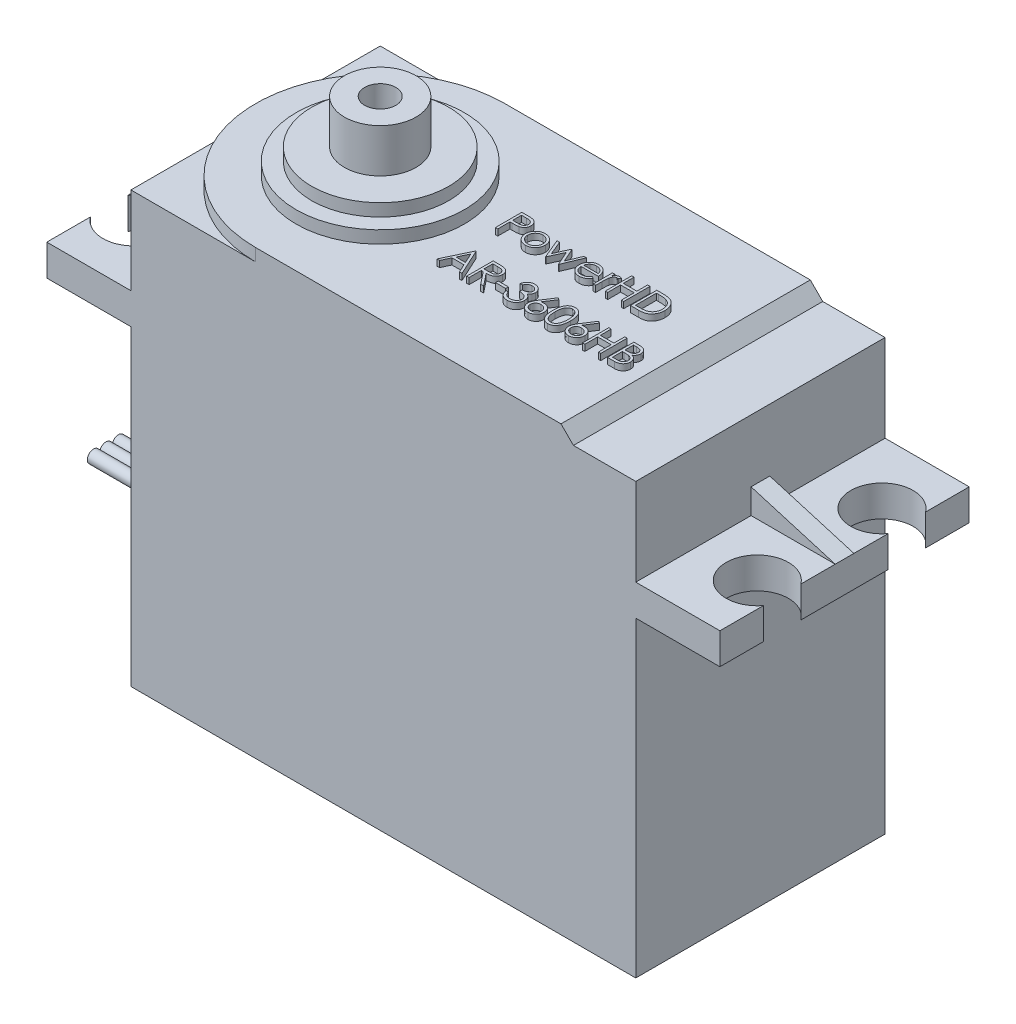
from build123d import *

# Parameters (mm, degrees)
Y_KSEKLIK_EKSTR_ZYON1_DEPTH   = 20
Y_KSEKLIK_EKSTR_ZYON2_DEPTH   = 1
IZIM3_R                       = 6.75
Y_KSEKLIK_EKSTR_ZYON3_DEPTH   = 1
IZIM4_R                       = 5.5
Y_KSEKLIK_EKSTR_ZYON4_DEPTH   = 1
IZIM5_R                       = 2.875
IZIM5_R_2                     = 1.25
Y_KSEKLIK_EKSTR_ZYON5_DEPTH   = 3.5
KES_EKSTR_ZYON1_DEPTH         = 67.306579613
IZIM7_R                       = 2.5
KES_EKSTR_ZYON2_DEPTH         = 3.5
FEDER14_REACH                 = 66.004
IZIM12_WALL_W                 = 137.04885268
IZIM12_WALL_H                 = 1.5
FEDER16_REACH                 = 66.004
IZIM13_WALL_W                 = 137.04885268
IZIM13_WALL_H                 = 1.5
IZIM14_R                      = 2.25
KES_EKSTR_ZYON3_DEPTH         = 7
IZIM15_W                      = 7
IZIM15_H                      = 3
Y_KSEKLIK_EKSTR_ZYON6_DEPTH   = 6
IZIM16_R                      = 0.5
Y_KSEKLIK_EKSTR_ZYON8_DEPTH   = 6
Y_KSEKLIK_EKSTR_ZYON8_2_DEPTH = 6
Y_KSEKLIK_EKSTR_ZYON8_3_DEPTH = 6
PAH1_SIZE                     = 1
IZIM17_W                      = 0.814102564
IZIM17_H                      = 0.217094017
Y_KSEKLIK_EKSTR_ZYON9_DEPTH   = 0.5


with BuildPart() as part:
    # Çizim1 → Yükseklik-Ekstrüzyon1 (new body)
    with BuildSketch(Plane.XY):
        Polygon((0, 0), (0, 26), (-6.75, 26), (-6.75, 28.5), (0, 28.5), (0, 35.5), (40.5, 35.5), (40.5, 28.5), (47.25, 28.5), (47.25, 26), (40.5, 26), (40.5, 0), align=None)
    extrude(amount=Y_KSEKLIK_EKSTR_ZYON1_DEPTH)

    # Çizim2 → Yükseklik-Ekstrüzyon2 (add)
    with BuildSketch(Plane(origin=(0, 35.5, 0), x_dir=(1, 0, 0), z_dir=(0, 1, 0))):
        with BuildLine():
            Line((35.5, 0), (35.5, -20))
            Line((35.5, -20), (10, -20))
            ThreePointArc((10, -20), (0, -10), (10, 0))
            Line((10, 0), (35.5, 0))
        make_face()
    extrude(amount=Y_KSEKLIK_EKSTR_ZYON2_DEPTH)

    # Çizim3 → Yükseklik-Ekstrüzyon3 (add)
    with BuildSketch(Plane(origin=(0, 36.5, 0), x_dir=(1, 0, 0), z_dir=(0, 1, 0))):
        with Locations((10, -10)):
            Circle(IZIM3_R)
    extrude(amount=Y_KSEKLIK_EKSTR_ZYON3_DEPTH)

    # Çizim4 → Yükseklik-Ekstrüzyon4 (add)
    with BuildSketch(Plane(origin=(0, 37.5, 0), x_dir=(1, 0, 0), z_dir=(0, 1, 0))):
        with Locations((10, -10)):
            Circle(IZIM4_R)
    extrude(amount=Y_KSEKLIK_EKSTR_ZYON4_DEPTH)

    # Çizim5 → Yükseklik-Ekstrüzyon5 (add)
    with BuildSketch(Plane(origin=(0, 38.5, 0), x_dir=(1, 0, 0), z_dir=(0, 1, 0))):
        with Locations((10, -10)):
            Circle(IZIM5_R)
        with Locations((10, -10)):
            Circle(IZIM5_R_2, mode=Mode.SUBTRACT)
    extrude(amount=Y_KSEKLIK_EKSTR_ZYON5_DEPTH)

    # Çizim6 → Kes-Ekstrüzyon1 (cut, through all)
    with BuildSketch(Plane.XY.offset(20)):
        Polygon((35.5, 35.5), (35.5, 36.5), (34.5, 36.5), align=None)
    extrude(amount=-KES_EKSTR_ZYON1_DEPTH, mode=Mode.SUBTRACT)

    # Çizim7 → Kes-Ekstrüzyon2 (cut)
    with BuildSketch(Plane(origin=(0, 28.5, 0), x_dir=(1, 0, 0), z_dir=(0, 1, 0))):
        with Locations((-4.75, -5)):
            Circle(IZIM7_R)
        with Locations((-4.75, -15)):
            Circle(IZIM7_R)
        with Locations((45.25, -15)):
            Circle(IZIM7_R)
        with Locations((45.25, -5)):
            Circle(IZIM7_R)
    extrude(amount=-KES_EKSTR_ZYON2_DEPTH, mode=Mode.SUBTRACT)

    # Çizim12 wall → Feder14 (add, up to next)
    with BuildSketch(Plane(origin=(-3.375, 29.5, 10), x_dir=(0.958798112708, 0.284088329691, 0), z_dir=(-0.284088329691, 0.958798112708, 0)), mode=Mode.PRIVATE) as feder14_sk1:
        Rectangle(IZIM12_WALL_W, IZIM12_WALL_H)
    feder14_tool1 = extrude(feder14_sk1.sketch, amount=-FEDER14_REACH, mode=Mode.PRIVATE) - part.part
    add(feder14_tool1.solids().sort_by_distance((-3.375, 29.5, 10))[0])

    # Çizim13 wall → Feder16 (add, up to next)
    with BuildSketch(Plane(origin=(43.875, 29.5, 10), x_dir=(-0.958798112708, 0.284088329691, 0), z_dir=(-0.284088329691, -0.958798112708, 0)), mode=Mode.PRIVATE) as feder16_sk1:
        Rectangle(IZIM13_WALL_W, IZIM13_WALL_H)
    feder16_tool1 = extrude(feder16_sk1.sketch, amount=FEDER16_REACH, mode=Mode.PRIVATE) - part.part
    add(feder16_tool1.solids().sort_by_distance((43.875, 29.5, 10))[0])

    # Çizim14 → Kes-Ekstrüzyon3 (cut)
    with BuildSketch(Plane.ZY):
        with Locations((10, 15)):
            Circle(IZIM14_R)
    extrude(amount=-KES_EKSTR_ZYON3_DEPTH, mode=Mode.SUBTRACT)

    # Çizim15 → Yükseklik-Ekstrüzyon6 (add)
    with BuildSketch(Plane.ZY):
        with Locations((10, 6.5)):
            Rectangle(IZIM15_W, IZIM15_H)
    extrude(amount=Y_KSEKLIK_EKSTR_ZYON6_DEPTH)

    # Pah1
    pah1_edges = [part.edges().sort_by_distance(p)[0] for p in [
        (0, 0, 10),
        (20.25, 0, 20),
        (40.5, 0, 10),
        (20.25, 0, 0),
    ]]
    chamfer(pah1_edges, length=PAH1_SIZE)

    # Çizim17 → Yükseklik-Ekstrüzyon9 (add)
    # profile 1 of 16: a face of its own
    with BuildSketch(Plane(origin=(0, 36.5, 0), x_dir=(1, 0, 0), z_dir=(0, 1, 0))):
        with BuildLine():
            Line((18.731786716, -7.372731881), (19.146894221, -7.372731881))
            add(Edge.make_bspline(
                [(19.146894221, -7.372731881), (19.175445579, -7.372763266), (19.230151248, -7.372823401), (19.308597972, -7.374646604), (19.379844809, -7.377081794), (19.443738135, -7.380457511), (19.500474537, -7.384446877), (19.549797285, -7.390042158), (19.592094064, -7.395884337), (19.617437488, -7.401823949), (19.628995583, -7.404532763)],
                knots=[0, 0, 0, 0, 1.415646017, 2.712440637, 3.8905458, 4.950247383, 5.884950622, 6.709939814, 7.411656543, 8, 8, 8, 8], degree=3))
            add(Edge.make_bspline(
                [(19.628995583, -7.404532763), (19.643626911, -7.408537466), (19.672544797, -7.416452506), (19.714213523, -7.432305567), (19.753857992, -7.451102877), (19.79161422, -7.472525926), (19.827018241, -7.497493862), (19.860598276, -7.524994574), (19.892057978, -7.555662999), (19.921220439, -7.589155161), (19.948002197, -7.624908811), (19.971061577, -7.663457684), (19.990369948, -7.704152901), (20.006930307, -7.746966155), (20.018849229, -7.79225697), (20.027828069, -7.839710649), (20.03352712, -7.889322104), (20.034072955, -7.923224976), (20.034350818, -7.940483617)],
                knots=[0, 0, 0, 0, 0.999701418, 1.975846123, 2.934577507, 3.890451536, 4.834027766, 5.787354733, 6.749476667, 7.726910423, 8.712836071, 9.690891519, 10.682875813, 11.679750201, 12.712814741, 13.765529915, 14.8625177, 16, 16, 16, 16], degree=3))
            add(Edge.make_bspline(
                [(20.034350818, -7.940483617), (20.034095957, -7.95788732), (20.033597303, -7.991938841), (20.027612406, -8.041754765), (20.019550814, -8.089360649), (20.007154978, -8.134650936), (19.990919737, -8.177356663), (19.971874544, -8.218130456), (19.948903551, -8.256278639), (19.922508821, -8.291939705), (19.893146666, -8.325147128), (19.860941318, -8.355660266), (19.826022793, -8.383300509), (19.788502066, -8.408129821), (19.748013348, -8.429572428), (19.705170712, -8.448778037), (19.659601772, -8.464907678), (19.628067966, -8.473392525), (19.612035113, -8.477706507)],
                knots=[0, 0, 0, 0, 1.121902311, 2.195077645, 3.232258892, 4.234102512, 5.217864754, 6.176164875, 7.132989551, 8.084763148, 9.034132444, 9.988522005, 10.94243251, 11.903244335, 12.886203696, 13.894208494, 14.929344452, 16, 16, 16, 16], degree=3))
            add(Edge.make_bspline(
                [(19.612035113, -8.477706507), (19.598774297, -8.480526501), (19.569712447, -8.48670668), (19.521849944, -8.49360608), (19.466123924, -8.49949501), (19.40261045, -8.50391046), (19.331366532, -8.507690445), (19.252353628, -8.510694959), (19.165416639, -8.51234587), (19.10477641, -8.512431016), (19.073116176, -8.512475471)],
                knots=[0, 0, 0, 0, 0.601384939, 1.31797006, 2.144135048, 3.087295005, 4.142315834, 5.309527816, 6.595305764, 8, 8, 8, 8], degree=3))
            Line((19.073116176, -8.512475471), (18.921743981, -8.512475471))
            Line((18.921743981, -8.512475471), (18.921743981, -9.489398548))
            Line((18.921743981, -9.489398548), (18.731786716, -9.489398548))
            Line((18.731786716, -9.489398548), (18.731786716, -7.372731881))
        make_face()
        with BuildLine():
            Line((18.921743981, -7.589825898), (18.921743981, -8.295381454))
            Line((18.921743981, -8.295381454), (19.292330252, -8.300045583))
            add(Edge.make_bspline(
                [(19.292330252, -8.300045583), (19.310424683, -8.300054935), (19.34535561, -8.300072988), (19.395814659, -8.297662877), (19.442628847, -8.29488065), (19.485654376, -8.29080702), (19.524910641, -8.285048926), (19.560463099, -8.279236114), (19.592036075, -8.27082668), (19.628986545, -8.259503681), (19.67016076, -8.240192052), (19.714953991, -8.212161404), (19.752915251, -8.176431642), (19.785764887, -8.13625862), (19.81183368, -8.091567242), (19.830917542, -8.043749361), (19.842130528, -7.993295376), (19.843634083, -7.958770644), (19.844393553, -7.941331641)],
                knots=[0, 0, 0, 0, 1.160613943, 2.240541288, 3.23993089, 4.169200891, 5.011653406, 5.7853311, 6.478053781, 7.106038997, 8.262395093, 9.384106736, 10.481365981, 11.59014053, 12.70357646, 13.786202915, 14.881775077, 16, 16, 16, 16], degree=3))
            add(Edge.make_bspline(
                [(19.844393553, -7.941331641), (19.843629953, -7.92431454), (19.842112009, -7.890486649), (19.830829654, -7.840909018), (19.811870783, -7.793595044), (19.785589891, -7.749463702), (19.753694064, -7.709435235), (19.716622557, -7.674663163), (19.674462632, -7.646710038), (19.635244892, -7.628668006), (19.600409889, -7.617652101), (19.570152466, -7.609944507), (19.535989058, -7.603790688), (19.497908544, -7.598807751), (19.456206078, -7.594542086), (19.410523382, -7.591647709), (19.361033512, -7.589953495), (19.326676643, -7.58986946), (19.30886671, -7.589825898)],
                knots=[0, 0, 0, 0, 1.120700087, 2.227813068, 3.331159281, 4.466773991, 5.599788987, 6.693661531, 7.80175334, 8.91857717, 9.525282508, 10.207424825, 10.974604443, 11.810962634, 12.737642355, 13.736264703, 14.826523623, 16, 16, 16, 16], degree=3))
            Line((19.30886671, -7.589825898), (18.921743981, -7.589825898))
        make_face(mode=Mode.SUBTRACT)
    # profile 2 of 16: a face of its own
    with BuildSketch(Plane(origin=(0, 36.5, 0), x_dir=(1, 0, 0), z_dir=(0, 1, 0))):
        with BuildLine():
            add(Edge.make_bspline(
                [(21.161374055, -7.915466924), (21.190397349, -7.916084925), (21.247304935, -7.917296673), (21.330645894, -7.930247629), (21.410199381, -7.950051987), (21.486270078, -7.977430503), (21.557883743, -8.014128635), (21.626083495, -8.057919016), (21.690682353, -8.109797061), (21.729401042, -8.149927893), (21.749054344, -8.170297987)],
                knots=[0, 0, 0, 0, 1.054011418, 2.066658804, 3.057071809, 4.030435133, 4.997543892, 5.974964718, 6.972108034, 8, 8, 8, 8], degree=3))
            add(Edge.make_bspline(
                [(21.749054344, -8.170297987), (21.765976764, -8.189779778), (21.799494108, -8.228366335), (21.842471947, -8.290932348), (21.879496415, -8.3557266), (21.909167824, -8.423609507), (21.932563053, -8.493988475), (21.94917326, -8.567105405), (21.959053216, -8.642798825), (21.960385486, -8.694205908), (21.96106022, -8.72024123)],
                knots=[0, 0, 0, 0, 1.025258237, 2.030674902, 3.01204498, 3.988269485, 4.97094183, 5.956517959, 6.965070386, 8, 8, 8, 8], degree=3))
            add(Edge.make_bspline(
                [(21.96106022, -8.72024123), (21.960466745, -8.746427455), (21.959294009, -8.798172657), (21.948200489, -8.874384369), (21.930945975, -8.948283143), (21.906252435, -9.019559591), (21.874588245, -9.088431587), (21.835949591, -9.154598314), (21.790065327, -9.218190318), (21.738053387, -9.278667621), (21.680569633, -9.334406236), (21.618208915, -9.382985714), (21.552196713, -9.42460635), (21.481655257, -9.458132182), (21.407228729, -9.484566144), (21.328756597, -9.503132344), (21.246360769, -9.514357743), (21.19010145, -9.515799238), (21.161374055, -9.5165353)],
                knots=[0, 0, 0, 0, 0.998656419, 1.973391657, 2.932242238, 3.890759089, 4.846373663, 5.82037756, 6.809684879, 7.83454468, 8.860553229, 9.859544525, 10.845671541, 11.83227036, 12.833544569, 13.85385346, 14.904124723, 16, 16, 16, 16], degree=3))
            add(Edge.make_bspline(
                [(21.161374055, -9.5165353), (21.132505916, -9.515796767), (21.075966205, -9.514350313), (20.99327954, -9.503175956), (20.91466677, -9.4845747), (20.840142808, -9.458045312), (20.769298068, -9.424605278), (20.702903377, -9.383111542), (20.640491999, -9.334391829), (20.582996085, -9.278671524), (20.530987404, -9.218189313), (20.485102299, -9.154598575), (20.446463864, -9.088431519), (20.414799617, -9.019559609), (20.390106092, -8.948283138), (20.372851574, -8.87438437), (20.361758055, -8.798172657), (20.360585319, -8.746427455), (20.359991844, -8.72024123)],
                knots=[0, 0, 0, 0, 1.099876186, 2.154163076, 3.173186993, 4.173200201, 5.163417411, 6.152872554, 7.150605724, 8.17532212, 9.198891216, 10.186952605, 11.159729845, 12.11414092, 13.071450619, 14.029093627, 15.002601286, 16, 16, 16, 16], degree=3))
            add(Edge.make_bspline(
                [(20.359991844, -8.72024123), (20.360671179, -8.694347414), (20.362016146, -8.643082108), (20.371886168, -8.567530981), (20.388431581, -8.494537798), (20.411854854, -8.424430487), (20.441799755, -8.356845056), (20.478303963, -8.291890706), (20.521720203, -8.229607608), (20.55510424, -8.191070921), (20.57199772, -8.171570022)],
                knots=[0, 0, 0, 0, 1.031353054, 2.041901799, 3.029428768, 4.008703097, 4.981709435, 5.96992636, 6.972712378, 8, 8, 8, 8], degree=3))
            add(Edge.make_bspline(
                [(20.57199772, -8.171570022), (20.591621392, -8.151023273), (20.630214795, -8.110614476), (20.695135216, -8.058887664), (20.763167194, -8.014186038), (20.835572268, -7.978217089), (20.911580473, -7.949890938), (20.991541634, -7.930196555), (21.075165398, -7.917343335), (21.132351454, -7.916098628), (21.161374055, -7.915466924)],
                knots=[0, 0, 0, 0, 1.027980169, 2.021703884, 2.998553061, 3.971491411, 4.943284454, 5.930300938, 6.949603206, 8, 8, 8, 8], degree=3))
        make_face()
        with BuildLine():
            add(Edge.make_bspline(
                [(21.160526032, -8.105424189), (21.140001857, -8.106007537), (21.099483337, -8.107159175), (21.039841969, -8.115918489), (20.982425781, -8.129796265), (20.927125841, -8.149513956), (20.874128637, -8.174973766), (20.823383427, -8.206245013), (20.774740952, -8.242913515), (20.729152751, -8.284921893), (20.687313925, -8.330810618), (20.650739148, -8.379704625), (20.619639203, -8.430810844), (20.593731107, -8.48418242), (20.574434855, -8.540360213), (20.560420694, -8.598708023), (20.551669644, -8.659344727), (20.550528834, -8.700565915), (20.549949109, -8.721513265)],
                knots=[0, 0, 0, 0, 1.021534396, 2.016698045, 2.994645724, 3.958388632, 4.93408049, 5.916473867, 6.921342795, 7.962252576, 8.998418191, 10.008913653, 10.997312074, 11.973003931, 12.956656626, 13.948281152, 14.957379055, 16, 16, 16, 16], degree=3))
            add(Edge.make_bspline(
                [(20.549949109, -8.721513265), (20.550920855, -8.748577586), (20.552849588, -8.802295203), (20.568534231, -8.881404786), (20.5947726, -8.957351906), (20.630203955, -9.02969134), (20.67459724, -9.096621718), (20.726901323, -9.156294472), (20.786554856, -9.207811606), (20.85284674, -9.250556689), (20.924422922, -9.28451997), (21.000173174, -9.308588874), (21.079179689, -9.324235088), (21.133173274, -9.325790218), (21.160526032, -9.326578035)],
                knots=[0, 0, 0, 0, 1.016792936, 2.018143844, 3.017858371, 4.030088057, 5.03801393, 6.028138512, 7.003788237, 7.991172063, 8.984598303, 9.972568034, 10.972917682, 12, 12, 12, 12], degree=3))
            add(Edge.make_bspline(
                [(21.160526032, -9.326578035), (21.187877217, -9.325785628), (21.241867696, -9.324221437), (21.320764437, -9.308667675), (21.396307648, -9.284414508), (21.467809487, -9.250594886), (21.534071195, -9.207649283), (21.594153759, -9.156585379), (21.646011252, -9.096463669), (21.690360623, -9.029602687), (21.726372225, -8.957464055), (21.75248778, -8.881390769), (21.768210129, -8.802298772), (21.770133773, -8.748578782), (21.771102955, -8.721513265)],
                knots=[0, 0, 0, 0, 1.02726834, 2.027799167, 3.010890988, 4.004497153, 4.992059811, 5.971914811, 6.958719428, 7.966827853, 8.981595046, 9.981490638, 10.983022906, 12, 12, 12, 12], degree=3))
            add(Edge.make_bspline(
                [(21.771102955, -8.721513265), (21.77052343, -8.700565789), (21.769383013, -8.659344356), (21.760629106, -8.598709443), (21.746625517, -8.540355002), (21.727290301, -8.484201647), (21.701494779, -8.430672657), (21.669795099, -8.379854679), (21.633369669, -8.330641244), (21.591025982, -8.285070232), (21.545485368, -8.242897139), (21.496823178, -8.206230794), (21.446153215, -8.1751112), (21.393309977, -8.149296188), (21.338002948, -8.129975654), (21.280667207, -8.115838358), (21.221280308, -8.107196191), (21.180906982, -8.106018634), (21.160526032, -8.105424189)],
                knots=[0, 0, 0, 0, 1.042956736, 2.052379634, 3.044323526, 4.02829302, 5.004299113, 5.996692471, 7.007513377, 8.048758398, 9.090003419, 10.095195979, 11.07790575, 12.047570684, 13.018257071, 13.989683339, 14.985167495, 16, 16, 16, 16], degree=3))
        make_face(mode=Mode.SUBTRACT)
    # profile 3 of 16: a face of its own
    with BuildSketch(Plane(origin=(0, 36.5, 0), x_dir=(1, 0, 0), z_dir=(0, 1, 0))):
        Polygon((22.123880733, -7.942603676), (22.327830386, -7.942603676), (22.78873116, -9.055210514), (23.293729157, -7.942603676), (23.32595405, -7.942603676), (23.819927741, -9.055210514), (24.285068633, -7.942603676), (24.484778169, -7.942603676), (23.838160247, -9.489398548), (23.798727154, -9.489398548), (23.304329451, -8.37679171), (22.799755466, -9.489398548), (22.76456249, -9.489398548), align=None)
    # profile 4 of 16: a face of its own
    with BuildSketch(Plane(origin=(0, 36.5, 0), x_dir=(1, 0, 0), z_dir=(0, 1, 0))):
        with BuildLine():
            Line((25.998500124, -9.000937009), (26.167256801, -9.089555466))
            add(Edge.make_bspline(
                [(26.167256801, -9.089555466), (26.153808955, -9.11340929), (26.127644773, -9.159819385), (26.082650035, -9.223580558), (26.035483401, -9.280940843), (25.984015763, -9.330367825), (25.929786957, -9.373457948), (25.872496256, -9.41115749), (25.8118454, -9.443281547), (25.747831519, -9.470346171), (25.679917028, -9.491155722), (25.607937349, -9.505853989), (25.531754588, -9.51493949), (25.479535708, -9.515994885), (25.452796999, -9.5165353)],
                knots=[0, 0, 0, 0, 1.120438281, 2.179929193, 3.190490725, 4.156257408, 5.095198341, 6.022838206, 6.959905092, 7.901321166, 8.864066838, 9.862729781, 10.905609505, 12, 12, 12, 12], degree=3))
            add(Edge.make_bspline(
                [(25.452796999, -9.5165353), (25.423077803, -9.515841532), (25.365104261, -9.514488192), (25.280715938, -9.502820844), (25.201262671, -9.483787561), (25.126748926, -9.457198876), (25.057357183, -9.422469018), (24.992949523, -9.380160189), (24.933187239, -9.33048973), (24.87995355, -9.273027405), (24.832029869, -9.21153403), (24.789741397, -9.147455948), (24.754388569, -9.080954379), (24.725630562, -9.012452681), (24.702404763, -8.942382612), (24.68621728, -8.870106629), (24.676885956, -8.795820347), (24.67545603, -8.745566244), (24.674735434, -8.72024123)],
                knots=[0, 0, 0, 0, 1.145258523, 2.234067595, 3.276747158, 4.290159414, 5.277019952, 6.260822364, 7.254936242, 8.264827045, 9.274100331, 10.257902744, 11.220704747, 12.172965371, 13.118907548, 14.062713208, 15.023725156, 16, 16, 16, 16], degree=3))
            add(Edge.make_bspline(
                [(24.674735434, -8.72024123), (24.675375962, -8.696477213), (24.676645405, -8.649380071), (24.684646881, -8.57967186), (24.698827515, -8.51192132), (24.71828653, -8.446072154), (24.743415141, -8.382234616), (24.774156531, -8.320369853), (24.810558588, -8.260543697), (24.83866349, -8.222804659), (24.85282037, -8.203794915)],
                knots=[0, 0, 0, 0, 1.024358464, 2.0301432, 3.019427413, 4.004406732, 4.986367066, 5.972626655, 6.978780325, 8, 8, 8, 8], degree=3))
            add(Edge.make_bspline(
                [(24.85282037, -8.203794915), (24.871995968, -8.180893265), (24.909739731, -8.135815432), (24.973576194, -8.076586063), (25.042700598, -8.026969113), (25.116246677, -7.985840988), (25.195069211, -7.954590735), (25.278108639, -7.931302816), (25.366310494, -7.918253257), (25.426608413, -7.916410044), (25.457461128, -7.915466924)],
                knots=[0, 0, 0, 0, 1.030682036, 2.02871468, 2.997146059, 3.962720338, 4.930598197, 5.918074684, 6.934738563, 8, 8, 8, 8], degree=3))
            add(Edge.make_bspline(
                [(25.457461128, -7.915466924), (25.489179442, -7.916285801), (25.551403543, -7.917892252), (25.642137254, -7.93278532), (25.727989687, -7.956402817), (25.808926488, -7.989757729), (25.884955861, -8.032792315), (25.955583614, -8.086097143), (26.022017624, -8.1480357), (26.060667098, -8.195668689), (26.080334392, -8.219907362)],
                knots=[0, 0, 0, 0, 1.056321875, 2.072262726, 3.055038591, 4.01806755, 4.982017516, 5.957941055, 6.960871419, 8, 8, 8, 8], degree=3))
            add(Edge.make_bspline(
                [(26.080334392, -8.219907362), (26.093715921, -8.238173337), (26.120389909, -8.274583704), (26.15380125, -8.33395388), (26.182804056, -8.396069335), (26.20598637, -8.461934134), (26.224757878, -8.53076788), (26.238338906, -8.603062657), (26.24630339, -8.678796937), (26.247868936, -8.730399187), (26.248667058, -8.75670624)],
                knots=[0, 0, 0, 0, 0.94817472, 1.890038105, 2.849395472, 3.817997239, 4.812318967, 5.836947057, 6.897266129, 8, 8, 8, 8], degree=3))
            Line((26.248667058, -8.75670624), (24.864692699, -8.75670624))
            add(Edge.make_bspline(
                [(24.864692699, -8.75670624), (24.865623794, -8.777086997), (24.867454755, -8.817164934), (24.875991056, -8.875809169), (24.889446267, -8.931673048), (24.908356605, -8.984337554), (24.93125703, -9.034490536), (24.959309345, -9.081759958), (24.992776599, -9.125930516), (25.03010595, -9.167397309), (25.071657384, -9.204324531), (25.115371236, -9.237375843), (25.161873535, -9.265077323), (25.210797614, -9.287562304), (25.26206436, -9.305164695), (25.315689926, -9.317179996), (25.371568787, -9.325227627), (25.409660159, -9.326122473), (25.429052341, -9.326578035)],
                knots=[0, 0, 0, 0, 1.094153842, 2.151609401, 3.174256925, 4.172055639, 5.149267565, 6.128595816, 7.11444997, 8.118368179, 9.117203808, 10.09244225, 11.054858984, 12.015122123, 12.976791628, 13.957293641, 14.960065497, 16, 16, 16, 16], degree=3))
            add(Edge.make_bspline(
                [(25.429052341, -9.326578035), (25.44801232, -9.326210306), (25.485632557, -9.32548066), (25.541658219, -9.318385647), (25.596775933, -9.306913147), (25.650757575, -9.291255867), (25.702507563, -9.27215939), (25.750432253, -9.249116233), (25.794507431, -9.223625672), (25.835701977, -9.194470297), (25.875659197, -9.158784394), (25.915296796, -9.114252315), (25.957797439, -9.061585096), (25.984400669, -9.021945574), (25.998500124, -9.000937009)],
                knots=[0, 0, 0, 0, 0.99110716, 1.966546729, 2.947904876, 3.932708344, 4.903319531, 5.828989031, 6.710028674, 7.56322171, 8.463672341, 9.504779593, 10.677557249, 12, 12, 12, 12], degree=3))
        make_face()
        with BuildLine():
            add(Edge.make_bspline(
                [(26.058709793, -8.566748975), (26.051757072, -8.541552856), (26.038375323, -8.493058438), (26.010413331, -8.425905138), (25.978922447, -8.366222455), (25.941655971, -8.314467153), (25.899432266, -8.268503124), (25.850661132, -8.228335694), (25.795968948, -8.192402283), (25.735638421, -8.162071962), (25.671750293, -8.136254761), (25.604859882, -8.118943382), (25.536607791, -8.107084278), (25.490443723, -8.105979917), (25.467213398, -8.105424189)],
                knots=[0, 0, 0, 0, 1.154881502, 2.222775134, 3.210006277, 4.132804581, 5.035138423, 5.962687519, 6.919655026, 7.923214229, 8.944639381, 9.960483929, 10.97369054, 12, 12, 12, 12], degree=3))
            add(Edge.make_bspline(
                [(25.467213398, -8.105424189), (25.448254452, -8.105794105), (25.410776602, -8.10652535), (25.355561194, -8.113462047), (25.302535852, -8.124928239), (25.251309321, -8.140630856), (25.202552891, -8.16156082), (25.155263674, -8.18610401), (25.110644101, -8.216064872), (25.082739603, -8.238899989), (25.068642351, -8.250436208)],
                knots=[0, 0, 0, 0, 1.04873581, 2.073130211, 3.073294108, 4.04793562, 5.032784715, 6.005352987, 6.992311501, 8, 8, 8, 8], degree=3))
            add(Edge.make_bspline(
                [(25.068642351, -8.250436208), (25.05854689, -8.259564675), (25.038116138, -8.278038468), (25.01081687, -8.309866607), (24.984678775, -8.34418779), (24.96089128, -8.382315079), (24.93907293, -8.423814313), (24.918656182, -8.468335454), (24.900279637, -8.516216347), (24.889940561, -8.549582536), (24.884621251, -8.566748975)],
                knots=[0, 0, 0, 0, 0.879870761, 1.780643979, 2.707998968, 3.669668524, 4.684282772, 5.740141944, 6.837334558, 8, 8, 8, 8], degree=3))
            Line((24.884621251, -8.566748975), (26.058709793, -8.566748975))
        make_face(mode=Mode.SUBTRACT)
    # profile 5 of 16: a face of its own
    with BuildSketch(Plane(origin=(0, 36.5, 0), x_dir=(1, 0, 0), z_dir=(0, 1, 0))):
        with BuildLine():
            Line((26.574308083, -7.942603676), (26.764265348, -7.942603676))
            Line((26.764265348, -7.942603676), (26.764265348, -8.170297987))
            add(Edge.make_bspline(
                [(26.764265348, -8.170297987), (26.778289026, -8.149097558), (26.805109201, -8.108551901), (26.849687973, -8.054928085), (26.895349511, -8.010529462), (26.94231241, -7.975148763), (26.990922023, -7.948652257), (27.040111513, -7.929243612), (27.090654773, -7.917766855), (27.124619365, -7.916234595), (27.141635808, -7.915466924)],
                knots=[0, 0, 0, 0, 1.2804753, 2.448899062, 3.506932113, 4.484331642, 5.4025378, 6.288909075, 7.142734305, 8, 8, 8, 8], degree=3))
            add(Edge.make_bspline(
                [(27.141635808, -7.915466924), (27.154835538, -7.916186909), (27.181994842, -7.917668325), (27.223108123, -7.928076776), (27.265467734, -7.944694438), (27.29276813, -7.96032162), (27.307000391, -7.968468393)],
                knots=[0, 0, 0, 0, 0.901110191, 1.854092781, 2.881294221, 4, 4, 4, 4], degree=3))
            Line((27.307000391, -7.968468393), (27.2026935, -8.132984953))
            add(Edge.make_bspline(
                [(27.2026935, -8.132984953), (27.193556139, -8.128908697), (27.17621168, -8.121171182), (27.150839157, -8.112013871), (27.127446158, -8.106621865), (27.112542673, -8.105805003), (27.105594809, -8.105424189)],
                knots=[0, 0, 0, 0, 1.180555205, 2.24091978, 3.179933427, 4, 4, 4, 4], degree=3))
            add(Edge.make_bspline(
                [(27.105594809, -8.105424189), (27.090351341, -8.106440212), (27.059259086, -8.108512603), (27.013608937, -8.124804168), (26.969311817, -8.151126575), (26.934131812, -8.180319105), (26.906891973, -8.208469439), (26.887454789, -8.233052045), (26.869624747, -8.260616265), (26.852588471, -8.290690883), (26.837066474, -8.323789409), (26.822579602, -8.359581162), (26.809481147, -8.398107597), (26.80201219, -8.424948454), (26.798186288, -8.438697426)],
                knots=[0, 0, 0, 0, 1.125678352, 2.296057538, 3.5422874, 4.923748041, 5.663163013, 6.437101912, 7.23742474, 8.08941207, 8.991984279, 9.93940061, 10.944477711, 12, 12, 12, 12], degree=3))
            add(Edge.make_bspline(
                [(26.798186288, -8.438697426), (26.795324317, -8.450960288), (26.788985268, -8.478121596), (26.782821814, -8.523689513), (26.776732154, -8.577527631), (26.772440389, -8.639785808), (26.76846224, -8.710308572), (26.766218523, -8.789203358), (26.764341862, -8.876551147), (26.764291627, -8.937616589), (26.764265348, -8.96956014)],
                knots=[0, 0, 0, 0, 0.566838948, 1.255505196, 2.06880316, 3.007127437, 4.065329342, 5.249902469, 6.561414163, 8, 8, 8, 8], degree=3))
            Line((26.764265348, -8.96956014), (26.764265348, -9.489398548))
            Line((26.764265348, -9.489398548), (26.574308083, -9.489398548))
            Line((26.574308083, -9.489398548), (26.574308083, -7.942603676))
        make_face()
    # profile 6 of 16: a face of its own
    with BuildSketch(Plane(origin=(0, 36.5, 0), x_dir=(1, 0, 0), z_dir=(0, 1, 0))):
        Polygon((27.55123116, -7.372731881), (27.741188425, -7.372731881), (27.741188425, -8.24110795), (28.826658511, -8.24110795), (28.826658511, -7.372731881), (29.016615775, -7.372731881), (29.016615775, -9.489398548), (28.826658511, -9.489398548), (28.826658511, -8.458201967), (27.741188425, -8.458201967), (27.741188425, -9.489398548), (27.55123116, -9.489398548), align=None)
    # profile 7 of 16: a face of its own
    with BuildSketch(Plane(origin=(0, 36.5, 0), x_dir=(1, 0, 0), z_dir=(0, 1, 0))):
        with BuildLine():
            Line((29.559350818, -9.489398548), (29.559350818, -7.372731881))
            Line((29.559350818, -7.372731881), (29.986754664, -7.372731881))
            add(Edge.make_bspline(
                [(29.986754664, -7.372731881), (30.023928767, -7.372999531), (30.095748939, -7.373516628), (30.19953361, -7.376795279), (30.29555998, -7.382595227), (30.383512233, -7.391043465), (30.463631823, -7.401416966), (30.53569441, -7.414419591), (30.600072611, -7.42977339), (30.639666034, -7.442863733), (30.65838928, -7.449053997)],
                knots=[0, 0, 0, 0, 1.314313732, 2.53924729, 3.670748893, 4.714932338, 5.66265055, 6.526160246, 7.303039223, 8, 8, 8, 8], degree=3))
            add(Edge.make_bspline(
                [(30.65838928, -7.449053997), (30.682878955, -7.4583859), (30.731302962, -7.476838089), (30.800250127, -7.511645947), (30.865156418, -7.551084347), (30.926369901, -7.595205273), (30.982492305, -7.645257998), (31.035716128, -7.699116331), (31.08386408, -7.758738804), (31.12795624, -7.822888915), (31.167710663, -7.890810966), (31.202266249, -7.962375532), (31.230964616, -8.037219177), (31.254788139, -8.115133766), (31.273563854, -8.196290623), (31.286373879, -8.280784247), (31.294823002, -8.368280709), (31.295672118, -8.427652885), (31.296102955, -8.457777955)],
                knots=[0, 0, 0, 0, 0.984719456, 1.947108742, 2.898477687, 3.838006223, 4.779231079, 5.722358779, 6.681677486, 7.655904652, 8.64651281, 9.637519902, 10.640069247, 11.656948941, 12.698408672, 13.768548281, 14.867775369, 16, 16, 16, 16], degree=3))
            add(Edge.make_bspline(
                [(31.296102955, -8.457777955), (31.295722579, -8.483940704), (31.29497301, -8.535497133), (31.288242423, -8.611479961), (31.278459601, -8.685208644), (31.263313824, -8.756332092), (31.244927543, -8.825473442), (31.221363508, -8.8918958), (31.19436966, -8.956208484), (31.162891877, -9.01754191), (31.128334944, -9.075649474), (31.09124989, -9.130426102), (31.051676269, -9.181090165), (31.00923672, -9.227795088), (30.964479672, -9.270470461), (30.917112101, -9.309472775), (30.86701178, -9.344038882), (30.814403104, -9.375527086), (30.75775135, -9.402995587), (30.695983469, -9.426236593), (30.628836042, -9.445496212), (30.556473888, -9.461565278), (30.478771975, -9.474312028), (30.395654124, -9.482855132), (30.307248039, -9.488632381), (30.246542484, -9.4891382), (30.215296999, -9.489398548)],
                knots=[0, 0, 0, 0, 1.105936401, 2.179363191, 3.223086493, 4.248585256, 5.251745608, 6.245858792, 7.225916811, 8.198733463, 9.158002045, 10.082870192, 10.993790845, 11.873723703, 12.748670949, 13.606408763, 14.465103618, 15.319838547, 16.196477973, 17.123216899, 18.106603292, 19.147568657, 20.255746949, 21.433717677, 22.679120308, 24, 24, 24, 24], degree=3))
            Line((30.215296999, -9.489398548), (29.559350818, -9.489398548))
        make_face()
        with BuildLine():
            Line((29.749308083, -9.272304531), (29.992266817, -9.272304531))
            add(Edge.make_bspline(
                [(29.992266817, -9.272304531), (30.027178737, -9.272154492), (30.094327143, -9.271865911), (30.190882218, -9.26933365), (30.279104519, -9.265195907), (30.359006575, -9.259405265), (30.430543271, -9.251743769), (30.49386411, -9.243201566), (30.548761528, -9.232559298), (30.581980759, -9.222912765), (30.597331587, -9.218455038)],
                knots=[0, 0, 0, 0, 1.375205317, 2.645023457, 3.804390687, 4.853969522, 5.800190428, 6.637939096, 7.370582563, 8, 8, 8, 8], degree=3))
            add(Edge.make_bspline(
                [(30.597331587, -9.218455038), (30.61665274, -9.211650525), (30.654833559, -9.198204023), (30.709794977, -9.173676294), (30.761052785, -9.144622281), (30.809500276, -9.11232662), (30.854450206, -9.075650228), (30.896435267, -9.03539063), (30.935370928, -8.991342933), (30.970854914, -8.943561806), (31.002609936, -8.892344644), (31.030109203, -8.838194969), (31.054209891, -8.781706088), (31.073125993, -8.722010549), (31.087952084, -8.659642024), (31.098453586, -8.594596123), (31.104993919, -8.526884996), (31.105756795, -8.480831092), (31.10614569, -8.457353943)],
                knots=[0, 0, 0, 0, 0.998632004, 1.973411704, 2.929992603, 3.868527914, 4.809262121, 5.754881198, 6.702106254, 7.672490631, 8.653608572, 9.636854334, 10.631411391, 11.644891563, 12.686317036, 13.754757253, 14.855430412, 16, 16, 16, 16], degree=3))
            add(Edge.make_bspline(
                [(31.10614569, -8.457353943), (31.105835273, -8.432598934), (31.105225457, -8.383967498), (31.097560517, -8.312611221), (31.086359386, -8.243982446), (31.070161633, -8.178076585), (31.049520578, -8.114765058), (31.023760961, -8.054398021), (30.994329244, -7.996337934), (30.959311511, -7.941924865), (30.920960176, -7.890463794), (30.878398316, -7.843319631), (30.832302131, -7.800384983), (30.783174388, -7.760991208), (30.729630524, -7.726723175), (30.672931863, -7.696069801), (30.612246624, -7.670055429), (30.570026565, -7.656219164), (30.548570236, -7.649187544)],
                knots=[0, 0, 0, 0, 1.122418816, 2.205001699, 3.251619955, 4.274784885, 5.280384055, 6.268708349, 7.249350384, 8.229342522, 9.199999885, 10.157847722, 11.105861043, 12.055065948, 13.010012805, 13.98527497, 14.976112212, 16, 16, 16, 16], degree=3))
            add(Edge.make_bspline(
                [(30.548570236, -7.649187544), (30.530819781, -7.644279037), (30.493077443, -7.633842206), (30.431488815, -7.622457338), (30.362173939, -7.612415569), (30.284825072, -7.603913803), (30.199530384, -7.597813375), (30.106224278, -7.593234532), (30.004866422, -7.590146236), (29.934603651, -7.589935351), (29.898136208, -7.589825898)],
                knots=[0, 0, 0, 0, 0.674548936, 1.434276114, 2.292660221, 3.240891867, 4.284742987, 5.42552168, 6.663806718, 8, 8, 8, 8], degree=3))
            Line((29.898136208, -7.589825898), (29.749308083, -7.589825898))
            Line((29.749308083, -7.589825898), (29.749308083, -9.272304531))
        make_face(mode=Mode.SUBTRACT)
    # profile 8 of 16: a face of its own
    with BuildSketch(Plane(origin=(0, 36.5, 0), x_dir=(1, 0, 0), z_dir=(0, 1, 0))):
        Polygon((19.600162784, -11.900509659), (20.577085861, -14.017176326), (20.370592138, -14.017176326), (20.057671465, -13.338757522), (19.09813287, -13.338757522), (18.77630795, -14.017176326), (18.568966203, -14.017176326), (19.573026032, -11.900509659), align=None)
        Polygon((19.584474349, -12.313073094), (19.201167725, -13.121663505), (19.957604691, -13.121663505), align=None, mode=Mode.SUBTRACT)
    # profile 9 of 16: a face of its own
    with BuildSketch(Plane(origin=(0, 36.5, 0), x_dir=(1, 0, 0), z_dir=(0, 1, 0))):
        with BuildLine():
            Line((20.957000391, -11.900509659), (21.380588131, -11.900509659))
            add(Edge.make_bspline(
                [(21.380588131, -11.900509659), (21.408855385, -11.900603752), (21.463131644, -11.900784419), (21.54088786, -11.901791809), (21.611540438, -11.904679158), (21.675052436, -11.907163873), (21.731422689, -11.911694713), (21.78082405, -11.9160252), (21.823028991, -11.921694033), (21.848577673, -11.926958741), (21.860145423, -11.929342458)],
                knots=[0, 0, 0, 0, 1.410062039, 2.707475311, 3.878576406, 4.937260626, 5.877586885, 6.699081471, 7.410979367, 8, 8, 8, 8], degree=3))
            add(Edge.make_bspline(
                [(21.860145423, -11.929342458), (21.875631334, -11.933168645), (21.906272799, -11.940739395), (21.95039022, -11.956741154), (21.992429835, -11.975258736), (22.032217014, -11.997008224), (22.069552469, -12.022151067), (22.104821161, -12.050253218), (22.138183132, -12.081160909), (22.168289166, -12.115653408), (22.196676116, -12.15184025), (22.220617809, -12.190970617), (22.241256204, -12.231889731), (22.257687898, -12.275013741), (22.270918863, -12.319924431), (22.280248064, -12.367028609), (22.28584283, -12.416111674), (22.286412429, -12.449590029), (22.286701246, -12.466565348)],
                knots=[0, 0, 0, 0, 1.027469482, 2.033020251, 3.019912614, 3.986113645, 4.951240523, 5.91722682, 6.890402269, 7.87763091, 8.8651537, 9.85103654, 10.82876324, 11.815024772, 12.821070561, 13.842952187, 14.906261191, 16, 16, 16, 16], degree=3))
            add(Edge.make_bspline(
                [(22.286701246, -12.466565348), (22.285812851, -12.494768483), (22.284079365, -12.549800103), (22.26791704, -12.629665494), (22.241442668, -12.704165698), (22.204961441, -12.773206913), (22.158503949, -12.83544335), (22.102669432, -12.890108054), (22.037426743, -12.935852192), (21.976690919, -12.96757365), (21.923039951, -12.987889361), (21.878872185, -13.002183731), (21.830692632, -13.013227872), (21.778962911, -13.023121856), (21.723467748, -13.03059169), (21.664340153, -13.036062726), (21.601537956, -13.039482079), (21.558394805, -13.039991292), (21.536200444, -13.040253249)],
                knots=[0, 0, 0, 0, 1.260483769, 2.459530307, 3.627416485, 4.787058657, 5.939039949, 7.08810263, 8.267026773, 9.491475466, 10.141966685, 10.831826277, 11.566392101, 12.351337768, 13.187381173, 14.07005841, 15.007169909, 16, 16, 16, 16], degree=3))
            Line((21.536200444, -13.040253249), (22.313837998, -14.017176326))
            Line((22.313837998, -14.017176326), (22.078935487, -14.017176326))
            Line((22.078935487, -14.017176326), (21.301297934, -13.040253249))
            Line((21.301297934, -13.040253249), (21.146957656, -13.040253249))
            Line((21.146957656, -13.040253249), (21.146957656, -14.017176326))
            Line((21.146957656, -14.017176326), (20.957000391, -14.017176326))
            Line((20.957000391, -14.017176326), (20.957000391, -11.900509659))
        make_face()
        with BuildLine():
            Line((21.146957656, -12.117603676), (21.146957656, -12.823159232))
            Line((21.146957656, -12.823159232), (21.534504397, -12.826127314))
            add(Edge.make_bspline(
                [(21.534504397, -12.826127314), (21.552598897, -12.826135319), (21.587671191, -12.826150835), (21.638411117, -12.823735551), (21.685655184, -12.820987925), (21.729222687, -12.816785226), (21.769133087, -12.811368935), (21.805366437, -12.804593797), (21.837981883, -12.796700407), (21.876020523, -12.784483233), (21.918496901, -12.765127212), (21.96465926, -12.736966173), (22.003970198, -12.701545801), (22.037182429, -12.661042806), (22.063870228, -12.616510408), (22.082685613, -12.568482413), (22.09462509, -12.518171304), (22.096033306, -12.483592162), (22.096743981, -12.466141336)],
                knots=[0, 0, 0, 0, 1.146690395, 2.22261258, 3.21895312, 4.145990853, 4.996080663, 5.770904154, 6.481378293, 7.121626537, 8.300444488, 9.431385265, 10.535395872, 11.636531494, 12.74115979, 13.810798291, 14.895190096, 16, 16, 16, 16], degree=3))
            add(Edge.make_bspline(
                [(22.096743981, -12.466141336), (22.096016984, -12.449119361), (22.094576341, -12.415388017), (22.082814466, -12.366005633), (22.062924222, -12.319398477), (22.03611982, -12.275756146), (22.003463189, -12.236140772), (21.965170988, -12.202245589), (21.922290227, -12.174275675), (21.882211931, -12.156402311), (21.846389335, -12.145444114), (21.815286636, -12.137732696), (21.780143028, -12.131537232), (21.74078787, -12.126573309), (21.69738917, -12.122306748), (21.64972749, -12.119433053), (21.598119056, -12.117731335), (21.562349246, -12.117647219), (21.543832656, -12.117603676)],
                knots=[0, 0, 0, 0, 1.101028733, 2.181837193, 3.264309656, 4.369019818, 5.486613113, 6.575447106, 7.666700264, 8.788928104, 9.402425223, 10.0903467, 10.862060571, 11.710948788, 12.657782767, 13.684531032, 14.801375019, 16, 16, 16, 16], degree=3))
            Line((21.543832656, -12.117603676), (21.146957656, -12.117603676))
        make_face(mode=Mode.SUBTRACT)
    # profile 10 of 16: a face of its own
    with BuildSketch(Plane(origin=(0, 36.5, 0), x_dir=(1, 0, 0), z_dir=(0, 1, 0))):
        with Locations((22.965120049, -13.203073762)):
            Rectangle(IZIM17_W, IZIM17_H)
    # profile 11 of 16: a face of its own
    with BuildSketch(Plane(origin=(0, 36.5, 0), x_dir=(1, 0, 0), z_dir=(0, 1, 0))):
        with BuildLine():
            Line((23.806359365, -12.388971197), (23.6164021, -12.388971197))
            add(Edge.make_bspline(
                [(23.6164021, -12.388971197), (23.621548352, -12.367663933), (23.631608854, -12.326009975), (23.652592625, -12.266497012), (23.675452174, -12.210179454), (23.702901776, -12.158111829), (23.732842784, -12.10924773), (23.767146525, -12.06469545), (23.804230358, -12.023321895), (23.845248303, -11.986604842), (23.888264208, -11.953356406), (23.933884192, -11.925008157), (23.981190419, -11.900621645), (24.030510647, -11.880531314), (24.081991712, -11.865396831), (24.135168199, -11.854416287), (24.190179458, -11.84728547), (24.227522049, -11.846589532), (24.246483564, -11.846236155)],
                knots=[0, 0, 0, 0, 1.162005537, 2.271625781, 3.343758855, 4.383309926, 5.390229558, 6.379919256, 7.361854164, 8.333198761, 9.295911338, 10.242430842, 11.177959212, 12.116337295, 13.062827104, 14.020064771, 14.994644689, 16, 16, 16, 16], degree=3))
            add(Edge.make_bspline(
                [(24.246483564, -11.846236155), (24.274110746, -11.847070261), (24.328762481, -11.848720278), (24.409052514, -11.86378758), (24.486478257, -11.887630398), (24.560192231, -11.920574033), (24.628662426, -11.961206361), (24.689583834, -12.009565987), (24.742130695, -12.064719851), (24.786214438, -12.125639068), (24.820731223, -12.190745019), (24.846183459, -12.257752733), (24.861678475, -12.326503259), (24.863686622, -12.372923137), (24.864692699, -12.396179397)],
                knots=[0, 0, 0, 0, 1.083050992, 2.142477498, 3.193116406, 4.255571735, 5.30263384, 6.308962982, 7.297363603, 8.282367274, 9.249857812, 10.179914175, 11.08814088, 12, 12, 12, 12], degree=3))
            add(Edge.make_bspline(
                [(24.864692699, -12.396179397), (24.863989003, -12.418559697), (24.86261198, -12.46235447), (24.850919691, -12.526290804), (24.831242999, -12.586550248), (24.803986524, -12.643386475), (24.768703777, -12.696439116), (24.725963622, -12.745827536), (24.675464393, -12.791770789), (24.637195702, -12.818089708), (24.617493847, -12.831639467)],
                knots=[0, 0, 0, 0, 1.024540389, 2.004866551, 2.965041327, 3.920577974, 4.882998113, 5.874504559, 6.905732034, 8, 8, 8, 8], degree=3))
            add(Edge.make_bspline(
                [(24.617493847, -12.831639467), (24.640010194, -12.84251198), (24.684621589, -12.864053573), (24.745430719, -12.906299674), (24.800632101, -12.955077561), (24.831416731, -12.993142879), (24.846884205, -13.012268473)],
                knots=[0, 0, 0, 0, 1.015518401, 2.012035669, 3.001164323, 4, 4, 4, 4], degree=3))
            add(Edge.make_bspline(
                [(24.846884205, -13.012268473), (24.857069207, -13.026212923), (24.877272425, -13.053873472), (24.902210105, -13.098345501), (24.924833713, -13.14331045), (24.942462655, -13.189973519), (24.956114469, -13.237793865), (24.965872927, -13.2868536), (24.971935146, -13.337192785), (24.972803313, -13.371248428), (24.973239707, -13.388366897)],
                knots=[0, 0, 0, 0, 1.025084078, 2.033381695, 3.024893161, 4.013698104, 4.991890475, 5.976764909, 6.982997093, 8, 8, 8, 8], degree=3))
            add(Edge.make_bspline(
                [(24.973239707, -13.388366897), (24.972154454, -13.41800611), (24.969989054, -13.477145052), (24.950634209, -13.56451786), (24.920630011, -13.649925663), (24.87802034, -13.73161378), (24.826090942, -13.80804382), (24.764310084, -13.876428064), (24.693379733, -13.935210077), (24.614273459, -13.98432293), (24.528568339, -14.023582816), (24.436901195, -14.050831841), (24.340592829, -14.068579184), (24.274548416, -14.07048229), (24.240971411, -14.07144983)],
                knots=[0, 0, 0, 0, 0.955779014, 1.907060117, 2.875433937, 3.871313158, 4.872415639, 5.851225146, 6.836215519, 7.83643374, 8.849228613, 9.86973379, 10.916971861, 12, 12, 12, 12], degree=3))
            add(Edge.make_bspline(
                [(24.240971411, -14.07144983), (24.218341644, -14.070924768), (24.173813808, -14.06989162), (24.108352264, -14.062828847), (24.045867236, -14.049929272), (23.986274241, -14.032570607), (23.929520338, -14.010562268), (23.875778713, -13.983155245), (23.824718729, -13.95091448), (23.776822221, -13.913459405), (23.732094897, -13.87156069), (23.691725392, -13.824474527), (23.65504066, -13.773071335), (23.623022969, -13.716754058), (23.594213955, -13.656250498), (23.570518805, -13.59078593), (23.549663247, -13.520945593), (23.539966818, -13.472275721), (23.534991844, -13.447304531)],
                knots=[0, 0, 0, 0, 1.048658725, 2.063410685, 3.046034179, 4.001477787, 4.936774919, 5.862367409, 6.792675028, 7.730719943, 8.675894397, 9.627829632, 10.600096036, 11.597688215, 12.626045268, 13.701542398, 14.82072376, 16, 16, 16, 16], degree=3))
            Line((23.534991844, -13.447304531), (23.724949109, -13.447304531))
            add(Edge.make_bspline(
                [(23.724949109, -13.447304531), (23.729898052, -13.463602267), (23.739524176, -13.495302781), (23.755909775, -13.540926204), (23.77457773, -13.58275036), (23.794604153, -13.621082057), (23.815636833, -13.656298796), (23.839171097, -13.687469355), (23.863463866, -13.715962834), (23.881775665, -13.732016004), (23.890737704, -13.73987264)],
                knots=[0, 0, 0, 0, 1.198163088, 2.33053128, 3.407730985, 4.417276592, 5.372219308, 6.28897303, 7.162600585, 8, 8, 8, 8], degree=3))
            add(Edge.make_bspline(
                [(23.890737704, -13.73987264), (23.902588967, -13.749009585), (23.926254911, -13.76725527), (23.964819508, -13.790539589), (24.005377796, -13.810715066), (24.048808575, -13.826126634), (24.09417465, -13.839175982), (24.142209295, -13.847715534), (24.192488726, -13.853574571), (24.226819707, -13.854091601), (24.244363505, -13.854355813)],
                knots=[0, 0, 0, 0, 0.946170439, 1.889420265, 2.845303464, 3.807233317, 4.801018734, 5.828864929, 6.890507805, 8, 8, 8, 8], degree=3))
            add(Edge.make_bspline(
                [(24.244363505, -13.854355813), (24.264171576, -13.853983337), (24.302904548, -13.853254992), (24.359422487, -13.846556827), (24.413190324, -13.836801767), (24.463611094, -13.821735344), (24.511345257, -13.803120258), (24.555723684, -13.779747174), (24.597328948, -13.752324414), (24.63562816, -13.721155494), (24.670066633, -13.687033924), (24.700389101, -13.651345066), (24.726166872, -13.614239398), (24.746960751, -13.575511582), (24.763380369, -13.535321991), (24.774558305, -13.493557842), (24.782330411, -13.450560924), (24.782963363, -13.421333405), (24.783282442, -13.406599403)],
                knots=[0, 0, 0, 0, 1.217147791, 2.380027433, 3.494444702, 4.572153297, 5.609568379, 6.639424714, 7.649109417, 8.668170816, 9.669597737, 10.625200337, 11.543417969, 12.441394052, 13.322311151, 14.205496177, 15.095365482, 16, 16, 16, 16], degree=3))
            add(Edge.make_bspline(
                [(24.783282442, -13.406599403), (24.782356974, -13.386877307), (24.780510643, -13.347531251), (24.766414502, -13.289644908), (24.743228618, -13.233871702), (24.710769527, -13.1811632), (24.671256968, -13.132313012), (24.625074381, -13.088726925), (24.571838262, -13.052761679), (24.522840532, -13.027912825), (24.479439699, -13.01095707), (24.442298014, -12.999663163), (24.40071664, -12.990099667), (24.355198419, -12.981202245), (24.305400379, -12.973629811), (24.251376733, -12.967314999), (24.193116534, -12.962262188), (24.152784258, -12.960005764), (24.132000391, -12.958842992)],
                knots=[0, 0, 0, 0, 1.07054697, 2.135767047, 3.216561865, 4.33974944, 5.486079747, 6.621378074, 7.775625952, 8.963672916, 9.598146892, 10.304877434, 11.070270905, 11.915000392, 12.823868403, 13.805723172, 14.86925407, 16, 16, 16, 16], degree=3))
            Line((24.132000391, -12.958842992), (24.132000391, -12.741748975))
            add(Edge.make_bspline(
                [(24.132000391, -12.741748975), (24.158187286, -12.741304594), (24.209480982, -12.74043416), (24.284407537, -12.729906459), (24.356055683, -12.715343412), (24.42283757, -12.693036653), (24.483706078, -12.667128474), (24.536513647, -12.636979756), (24.580520445, -12.603467027), (24.615512617, -12.56607302), (24.641837436, -12.525968206), (24.661085071, -12.484169084), (24.672454792, -12.440309295), (24.673972543, -12.410376806), (24.674735434, -12.395331374)],
                knots=[0, 0, 0, 0, 1.321986639, 2.589447074, 3.816329219, 5.01088745, 6.139805852, 7.153945165, 8.075214402, 8.924034688, 9.728124013, 10.488707548, 11.240355623, 12, 12, 12, 12], degree=3))
            add(Edge.make_bspline(
                [(24.674735434, -12.395331374), (24.674484814, -12.38427769), (24.673986217, -12.36228691), (24.66769834, -12.330158892), (24.658249515, -12.299013082), (24.645259393, -12.26898193), (24.627872368, -12.240273717), (24.607064938, -12.212643688), (24.582288992, -12.186249593), (24.553898174, -12.161647686), (24.523411034, -12.138201528), (24.489998075, -12.118296614), (24.454666751, -12.101275553), (24.417377945, -12.08723933), (24.378010649, -12.076680618), (24.336749826, -12.069099418), (24.293516798, -12.064359503), (24.264021512, -12.06367708), (24.249027634, -12.063330172)],
                knots=[0, 0, 0, 0, 0.884392785, 1.759457502, 2.611959086, 3.489218968, 4.37281399, 5.2945488, 6.255912374, 7.266815255, 8.301784654, 9.332968512, 10.37626691, 11.440494194, 12.520033166, 13.637162961, 14.798855837, 16, 16, 16, 16], degree=3))
            add(Edge.make_bspline(
                [(24.249027634, -12.063330172), (24.224926864, -12.064171615), (24.177852453, -12.065815148), (24.109989146, -12.080210304), (24.046900787, -12.103178002), (23.998677879, -12.130593685), (23.963067942, -12.157657043), (23.937621412, -12.181292581), (23.912632342, -12.207559098), (23.889744718, -12.238074401), (23.866598075, -12.270771936), (23.845525412, -12.307313877), (23.82504836, -12.346747011), (23.812709675, -12.374623895), (23.806359365, -12.388971197)],
                knots=[0, 0, 0, 0, 1.472543308, 2.876219568, 4.221790263, 5.565193594, 6.249813518, 6.953379497, 7.687249741, 8.463570142, 9.283606569, 10.136032583, 11.040678096, 12, 12, 12, 12], degree=3))
        make_face()
    # profile 12 of 16: a face of its own
    with BuildSketch(Plane(origin=(0, 36.5, 0), x_dir=(1, 0, 0), z_dir=(0, 1, 0))):
        with BuildLine():
            Line((26.140120049, -11.846236155), (26.286404103, -11.96114334))
            Line((26.286404103, -11.96114334), (25.727132602, -12.816375044))
            add(Edge.make_bspline(
                [(25.727132602, -12.816375044), (25.76436796, -12.810439995), (25.836999736, -12.79886301), (25.910518161, -12.796953205), (25.946346678, -12.79602248)],
                knots=[0, 0, 0, 0, 1.025318673, 2, 2, 2, 2], degree=3))
            add(Edge.make_bspline(
                [(25.946346678, -12.79602248), (25.967859569, -12.796600699), (26.010207054, -12.797738908), (26.072380691, -12.806498189), (26.132124477, -12.820301948), (26.189190785, -12.84042374), (26.243784445, -12.866127545), (26.296218752, -12.896933433), (26.345508062, -12.934432107), (26.392287109, -12.976320913), (26.434757782, -13.022716423), (26.472359492, -13.07194485), (26.503944266, -13.123954907), (26.5295704, -13.17872025), (26.549470017, -13.236156459), (26.56397683, -13.296190048), (26.572552108, -13.358862414), (26.573716571, -13.40148493), (26.574308083, -13.423135861)],
                knots=[0, 0, 0, 0, 1.04369286, 2.054478336, 3.041073146, 4.015093852, 4.984733326, 5.965804835, 6.960378782, 7.985147595, 9.009457201, 10.008161701, 10.986880575, 11.956520048, 12.937015923, 13.931873656, 14.949455224, 16, 16, 16, 16], degree=3))
            add(Edge.make_bspline(
                [(26.574308083, -13.423135861), (26.573447444, -13.45275692), (26.571753908, -13.511044154), (26.554878756, -13.595938639), (26.528656494, -13.676814969), (26.491174846, -13.752381887), (26.444618834, -13.822535822), (26.387845242, -13.884696556), (26.322867513, -13.940135102), (26.249396926, -13.986494105), (26.170328562, -14.024354046), (26.087263306, -14.051547311), (26.001007841, -14.068289219), (25.942464102, -14.070388107), (25.91284975, -14.07144983)],
                knots=[0, 0, 0, 0, 1.031375318, 2.029502543, 3.004789286, 3.987476834, 4.960371455, 5.9300674, 6.912260825, 7.929083631, 8.949397511, 9.960523116, 10.96833055, 12, 12, 12, 12], degree=3))
            add(Edge.make_bspline(
                [(25.91284975, -14.07144983), (25.884367459, -14.070525629), (25.827949029, -14.06869495), (25.744955863, -14.052386978), (25.665210133, -14.025954587), (25.589270555, -13.989539285), (25.51892428, -13.943542375), (25.455989348, -13.888168997), (25.40077956, -13.824602796), (25.354833004, -13.752853634), (25.318390818, -13.675752565), (25.291061673, -13.595357237), (25.275098231, -13.511960581), (25.272867532, -13.455426749), (25.271743981, -13.426951967)],
                knots=[0, 0, 0, 0, 1.012016664, 2.004627821, 2.994792927, 3.992885782, 4.990978636, 5.973936114, 6.964471063, 7.975201453, 8.993600317, 9.990122807, 10.98767138, 12, 12, 12, 12], degree=3))
            add(Edge.make_bspline(
                [(25.271743981, -13.426951967), (25.272458474, -13.405153576), (25.273917332, -13.360645427), (25.284103572, -13.293236229), (25.300471329, -13.22426248), (25.318801812, -13.165749229), (25.338169681, -13.11781488), (25.354288121, -13.079168483), (25.37435049, -13.039398692), (25.395742964, -12.997141778), (25.420391165, -12.953486779), (25.447191582, -12.907704083), (25.47688518, -12.860521813), (25.497701183, -12.82850318), (25.508342538, -12.812134926)],
                knots=[0, 0, 0, 0, 1.173818275, 2.396712641, 3.66331629, 4.989737886, 5.693666774, 6.447286557, 7.243889047, 8.091586357, 8.998013824, 9.943181721, 10.948533338, 12, 12, 12, 12], degree=3))
            Line((25.508342538, -12.812134926), (26.140120049, -11.846236155))
        make_face()
        with BuildLine():
            add(Edge.make_bspline(
                [(25.906489574, -13.013116497), (25.890365264, -13.013587028), (25.858869802, -13.014506112), (25.812661509, -13.019843288), (25.768929209, -13.029893866), (25.727093514, -13.042694457), (25.68793657, -13.060294879), (25.651173795, -13.0816743), (25.616663026, -13.106845203), (25.584765735, -13.135450992), (25.555846224, -13.166770422), (25.530941445, -13.200316276), (25.509458851, -13.235280103), (25.491992227, -13.27195404), (25.478391086, -13.310324066), (25.468552667, -13.350213707), (25.463077304, -13.391890454), (25.462166392, -13.420152491), (25.461701246, -13.434584178)],
                knots=[0, 0, 0, 0, 1.129588631, 2.206414736, 3.251139165, 4.268635594, 5.265702196, 6.250456724, 7.242448911, 8.251968645, 9.246821453, 10.222880186, 11.173611482, 12.116736599, 13.062300278, 14.020270554, 14.989073742, 16, 16, 16, 16], degree=3))
            add(Edge.make_bspline(
                [(25.461701246, -13.434584178), (25.462080045, -13.448886785), (25.462822815, -13.476932068), (25.469567313, -13.518261), (25.479869482, -13.558033112), (25.495194388, -13.596043364), (25.513474458, -13.632871138), (25.537607678, -13.667182477), (25.564348306, -13.701061281), (25.596312351, -13.731905028), (25.63061648, -13.760604987), (25.667265779, -13.785690664), (25.705462517, -13.80715135), (25.745722377, -13.823970442), (25.787474161, -13.837773701), (25.831065734, -13.847487072), (25.876527414, -13.852978628), (25.907323062, -13.853890726), (25.923026032, -13.854355813)],
                knots=[0, 0, 0, 0, 0.989467248, 1.94019797, 2.891935182, 3.827694429, 4.772920941, 5.730924762, 6.725747692, 7.756678648, 8.79901574, 9.819492441, 10.826891316, 11.826466727, 12.835195252, 13.867842842, 14.912794438, 16, 16, 16, 16], degree=3))
            add(Edge.make_bspline(
                [(25.923026032, -13.854355813), (25.938728976, -13.85389069), (25.969524574, -13.85297852), (26.014986619, -13.847487482), (26.05857684, -13.837772195), (26.100333538, -13.823975901), (26.140575261, -13.807131099), (26.178738593, -13.785824176), (26.215041297, -13.760450714), (26.249367945, -13.731954074), (26.281198946, -13.700885731), (26.308580919, -13.667484898), (26.331975065, -13.632593828), (26.350985264, -13.596188438), (26.366141378, -13.558010129), (26.376495789, -13.518267157), (26.383226359, -13.476930456), (26.383971043, -13.448886241), (26.384350818, -13.434584178)],
                knots=[0, 0, 0, 0, 1.087397944, 2.132534446, 3.165364764, 4.174271784, 5.174024072, 6.181601208, 7.194203697, 8.236725232, 9.267838612, 10.269026844, 11.221737037, 12.171628256, 13.107553087, 14.05945871, 15.010357665, 16, 16, 16, 16], degree=3))
            add(Edge.make_bspline(
                [(26.384350818, -13.434584178), (26.384018022, -13.420133664), (26.383364851, -13.391772004), (26.375977111, -13.35023235), (26.365731009, -13.310121392), (26.350259366, -13.271691222), (26.33015917, -13.235093495), (26.305676348, -13.200143336), (26.277353793, -13.166572793), (26.244637662, -13.135389571), (26.209023092, -13.106876814), (26.171155572, -13.081706892), (26.131538845, -13.060464644), (26.090213079, -13.042740825), (26.046704765, -13.029950429), (26.001716321, -13.019879182), (25.954672351, -13.014519771), (25.922755069, -13.013590213), (25.906489574, -13.013116497)],
                knots=[0, 0, 0, 0, 0.978206639, 1.919901502, 2.851605144, 3.780102724, 4.718870031, 5.675451981, 6.667674623, 7.690630536, 8.733308323, 9.756129687, 10.767539656, 11.776269907, 12.797430371, 13.836405707, 14.897401972, 16, 16, 16, 16], degree=3))
        make_face(mode=Mode.SUBTRACT)
    # profile 13 of 16: a face of its own
    with BuildSketch(Plane(origin=(0, 36.5, 0), x_dir=(1, 0, 0), z_dir=(0, 1, 0))):
        with BuildLine():
            add(Edge.make_bspline(
                [(26.7914021, -12.959691016), (26.791600473, -12.925765453), (26.791985815, -12.859864558), (26.796272622, -12.763837655), (26.803393901, -12.673752147), (26.813153169, -12.589603721), (26.825029471, -12.511370654), (26.840883599, -12.439262015), (26.858913246, -12.372944063), (26.879809249, -12.312200538), (26.903387579, -12.25621307), (26.929050203, -12.203946401), (26.957815579, -12.155479613), (26.988039712, -12.11003914), (27.02094606, -12.06836881), (27.055598186, -12.029880152), (27.093348558, -11.995462699), (27.132913902, -11.96410803), (27.17465243, -11.936621921), (27.217374423, -11.912411646), (27.26137394, -11.891728869), (27.306771107, -11.875466558), (27.353157892, -11.862034284), (27.400696452, -11.852848587), (27.449465277, -11.847068932), (27.482383335, -11.846516381), (27.499077715, -11.846236155)],
                knots=[0, 0, 0, 0, 1.646270934, 3.197905019, 4.663502075, 6.030701355, 7.308322542, 8.50163776, 9.611534131, 10.641858119, 11.616356847, 12.558055219, 13.465016945, 14.349605745, 15.204443733, 16.039544428, 16.859896111, 17.680448484, 18.487036065, 19.28249412, 20.06191084, 20.843045899, 21.620316918, 22.403196591, 23.190181807, 24, 24, 24, 24], degree=3))
            add(Edge.make_bspline(
                [(27.499077715, -11.846236155), (27.515911552, -11.846531167), (27.549388757, -11.847117853), (27.598882698, -11.852756618), (27.64723322, -11.862112964), (27.69423419, -11.875369934), (27.740271681, -11.891816844), (27.784985604, -11.912431433), (27.828653696, -11.936427701), (27.870582013, -11.964624046), (27.911230852, -11.996060946), (27.949601763, -12.03159837), (27.985698239, -12.070877486), (28.019973304, -12.113478041), (28.051454546, -12.160217116), (28.08143467, -12.210281792), (28.108269187, -12.264547601), (28.13411349, -12.322109122), (28.156421335, -12.384559049), (28.176539492, -12.451545357), (28.192794869, -12.52385927), (28.206335048, -12.60112138), (28.21682458, -12.683615429), (28.224464321, -12.771164582), (28.228499948, -12.863826437), (28.229259953, -12.927179994), (28.229649964, -12.959691016)],
                knots=[0, 0, 0, 0, 0.810914788, 1.612654377, 2.396697861, 3.181598691, 3.963628158, 4.749916497, 5.551656086, 6.361998678, 7.18212741, 8.025565596, 8.878627764, 9.750805457, 10.657531673, 11.591944965, 12.560506719, 13.57287815, 14.630710178, 15.753379473, 16.941251878, 18.199788006, 19.531962791, 20.947069417, 22.433333509, 24, 24, 24, 24], degree=3))
            add(Edge.make_bspline(
                [(28.229649964, -12.959691016), (28.22925591, -12.992060236), (28.228488113, -13.055130343), (28.224509562, -13.147375266), (28.216672675, -13.234459797), (28.206869492, -13.316592791), (28.193292005, -13.393432398), (28.176597452, -13.465244517), (28.158061304, -13.532339265), (28.135180262, -13.594166985), (28.110136642, -13.651590169), (28.082888976, -13.705212683), (28.053697224, -13.755508488), (28.021893554, -13.802075002), (27.987994585, -13.845242095), (27.951274779, -13.8842478), (27.912769235, -13.920031968), (27.872000774, -13.951873667), (27.82941855, -13.979744001), (27.785900442, -14.004668567), (27.740674301, -14.024766435), (27.694765039, -14.042023341), (27.647515979, -14.055207424), (27.598986019, -14.064323518), (27.54942201, -14.070716969), (27.515917254, -14.071204697), (27.499077715, -14.07144983)],
                knots=[0, 0, 0, 0, 1.561518951, 3.042555995, 4.452378317, 5.7783523, 7.031515105, 8.214008947, 9.334062868, 10.386615937, 11.391082383, 12.354592575, 13.286541444, 14.194233754, 15.072674879, 15.931287219, 16.775624067, 17.606195743, 18.42308326, 19.229000347, 20.022332153, 20.807536673, 21.593273796, 22.3848459, 23.188221202, 24, 24, 24, 24], degree=3))
            add(Edge.make_bspline(
                [(27.499077715, -14.07144983), (27.482383798, -14.071167796), (27.449466653, -14.07061168), (27.400691139, -14.064858138), (27.353348899, -14.055608), (27.307206319, -14.042656054), (27.262026665, -14.026802319), (27.218425577, -14.006147473), (27.175918264, -13.982359726), (27.134618132, -13.955269162), (27.095301254, -13.924231763), (27.057746383, -13.889902883), (27.022896967, -13.851425868), (26.990461109, -13.809408267), (26.959633922, -13.764236639), (26.931277016, -13.715294242), (26.905047975, -13.66277514), (26.881073102, -13.606340022), (26.85981653, -13.545165376), (26.841040058, -13.478551349), (26.82621483, -13.405909988), (26.813525138, -13.327824723), (26.803289916, -13.243960013), (26.7963023, -13.154270328), (26.791983505, -13.058811558), (26.791599438, -12.993334124), (26.7914021, -12.959691016)],
                knots=[0, 0, 0, 0, 0.810891512, 1.598919785, 2.382837074, 3.152667961, 3.926044502, 4.706494248, 5.493654104, 6.291793342, 7.103789334, 7.925228297, 8.761435821, 9.622817696, 10.50288917, 11.416980706, 12.369136599, 13.353924996, 14.394355917, 15.514179734, 16.714354668, 17.994756427, 19.357759367, 20.818452758, 22.365282078, 24, 24, 24, 24], degree=3))
        make_face()
        with BuildLine():
            add(Edge.make_bspline(
                [(26.981359365, -12.958842992), (26.981431602, -12.987114825), (26.9815718, -13.041984899), (26.98523436, -13.121718681), (26.990223786, -13.196086451), (26.996659237, -13.265182637), (27.006216258, -13.328773359), (27.016924649, -13.387295977), (27.029956112, -13.440440782), (27.045374528, -13.488572458), (27.062936268, -13.532507848), (27.082110766, -13.573390487), (27.102709394, -13.611703325), (27.125762404, -13.647102221), (27.150869133, -13.679702616), (27.177462485, -13.710081519), (27.206534952, -13.737173027), (27.246753882, -13.769664982), (27.299849845, -13.803240839), (27.366748882, -13.832478713), (27.435491231, -13.850852865), (27.482149368, -13.853189517), (27.505437891, -13.854355813)],
                knots=[0, 0, 0, 0, 1.459021318, 2.831673884, 4.118529203, 5.306027144, 6.411944654, 7.436330062, 8.375795394, 9.233974572, 10.042671642, 10.816086306, 11.563610507, 12.285937304, 12.993564865, 13.685989202, 14.367179055, 15.041617293, 16.353048772, 17.594441528, 18.799311195, 20, 20, 20, 20], degree=3))
            add(Edge.make_bspline(
                [(27.505437891, -13.854355813), (27.528877054, -13.853389536), (27.575706988, -13.851458977), (27.644125997, -13.832833074), (27.710547161, -13.804730067), (27.762600191, -13.771499909), (27.802201539, -13.739853728), (27.830575147, -13.712872489), (27.856617434, -13.682661083), (27.881317165, -13.650064842), (27.903970987, -13.614461007), (27.924571075, -13.576020783), (27.943369099, -13.534637423), (27.954078855, -13.505748104), (27.959554477, -13.490977741)],
                knots=[0, 0, 0, 0, 1.353760809, 2.704726607, 4.075137775, 5.516104923, 6.260822281, 7.007110065, 7.778089737, 8.566572457, 9.372053459, 10.217411131, 11.088608312, 12, 12, 12, 12], degree=3))
            add(Edge.make_bspline(
                [(27.959554477, -13.490977741), (27.965935785, -13.472091185), (27.978892575, -13.433743375), (27.995591124, -13.374256785), (28.008741913, -13.311843685), (28.020573091, -13.246877067), (28.028648511, -13.178877819), (28.035148379, -13.108056339), (28.038976937, -13.03435923), (28.039451525, -12.984287973), (28.039692699, -12.958842992)],
                knots=[0, 0, 0, 0, 0.884706709, 1.796334032, 2.740027952, 3.714592787, 4.726048262, 5.777819803, 6.87074269, 8, 8, 8, 8], degree=3))
            add(Edge.make_bspline(
                [(28.039692699, -12.958842992), (28.039359965, -12.933402127), (28.038709067, -12.883634356), (28.036221084, -12.810749552), (28.029796351, -12.74152381), (28.022660693, -12.675658905), (28.012139517, -12.613519437), (28.00079551, -12.554585204), (27.985554777, -12.499586328), (27.969274722, -12.447661723), (27.950641769, -12.399401328), (27.930130825, -12.354580133), (27.908225285, -12.312981752), (27.884432597, -12.274720316), (27.859035207, -12.239624445), (27.831362785, -12.208397809), (27.802512997, -12.180072595), (27.762104509, -12.14774047), (27.709203391, -12.114773873), (27.64337769, -12.084435532), (27.574875919, -12.067013374), (27.528567211, -12.064557021), (27.505437891, -12.063330172)],
                knots=[0, 0, 0, 0, 1.31362396, 2.569729283, 3.763502607, 4.902122613, 5.988968491, 7.01645872, 7.998833611, 8.933434873, 9.825090667, 10.667526885, 11.477055099, 12.250526234, 12.991942729, 13.710640831, 14.402115721, 15.076753259, 16.378508321, 17.609869233, 18.806226677, 20, 20, 20, 20], degree=3))
            add(Edge.make_bspline(
                [(27.505437891, -12.063330172), (27.482027199, -12.064558713), (27.435163168, -12.067018035), (27.365949405, -12.084370621), (27.299604392, -12.114616558), (27.246843165, -12.147849659), (27.206406494, -12.179501876), (27.177932674, -12.206949875), (27.151234751, -12.236974038), (27.126640475, -12.269874244), (27.103605528, -12.305231871), (27.082450344, -12.343325076), (27.063389864, -12.384346901), (27.045800644, -12.428262555), (27.030335196, -12.476390078), (27.017578371, -12.529469422), (27.005793344, -12.587805899), (26.997450491, -12.65174103), (26.990033838, -12.720854523), (26.985267499, -12.795407949), (26.981559548, -12.875275455), (26.981427429, -12.930429232), (26.981359365, -12.958842992)],
                knots=[0, 0, 0, 0, 1.207732386, 2.417664972, 3.655092373, 4.956220595, 5.625982001, 6.301752483, 6.994047911, 7.697131622, 8.419323945, 9.170223765, 9.943494443, 10.752040957, 11.610060368, 12.549350801, 13.567764191, 14.679664412, 15.874934091, 17.154273443, 18.533957287, 20, 20, 20, 20], degree=3))
        make_face(mode=Mode.SUBTRACT)
    # profile 14 of 16: a face of its own
    with BuildSketch(Plane(origin=(0, 36.5, 0), x_dir=(1, 0, 0), z_dir=(0, 1, 0))):
        with BuildLine():
            Line((29.396530305, -11.846236155), (29.54281436, -11.96114334))
            Line((29.54281436, -11.96114334), (28.983542859, -12.816375044))
            add(Edge.make_bspline(
                [(28.983542859, -12.816375044), (29.020778217, -12.810439995), (29.093409993, -12.79886301), (29.166928417, -12.796953205), (29.202756935, -12.79602248)],
                knots=[0, 0, 0, 0, 1.025318673, 2, 2, 2, 2], degree=3))
            add(Edge.make_bspline(
                [(29.202756935, -12.79602248), (29.224269825, -12.796600699), (29.26661731, -12.797738908), (29.328790948, -12.806498189), (29.388534733, -12.820301948), (29.445601041, -12.84042374), (29.500194702, -12.866127545), (29.552629008, -12.896933433), (29.601918319, -12.934432107), (29.648697365, -12.976320913), (29.691168039, -13.022716423), (29.728769748, -13.07194485), (29.760354522, -13.123954907), (29.785980656, -13.17872025), (29.805880273, -13.236156459), (29.820387087, -13.296190048), (29.828962364, -13.358862414), (29.830126828, -13.40148493), (29.83071834, -13.423135861)],
                knots=[0, 0, 0, 0, 1.04369286, 2.054478336, 3.041073146, 4.015093852, 4.984733326, 5.965804835, 6.960378782, 7.985147595, 9.009457201, 10.008161701, 10.986880575, 11.956520048, 12.937015923, 13.931873656, 14.949455224, 16, 16, 16, 16], degree=3))
            add(Edge.make_bspline(
                [(29.83071834, -13.423135861), (29.8298577, -13.45275692), (29.828164165, -13.511044154), (29.811289012, -13.595938639), (29.785066751, -13.676814969), (29.747585103, -13.752381887), (29.70102909, -13.822535822), (29.644255498, -13.884696556), (29.57927777, -13.940135102), (29.505807182, -13.986494105), (29.426738818, -14.024354046), (29.343673563, -14.051547311), (29.257418098, -14.068289219), (29.198874359, -14.070388107), (29.169260006, -14.07144983)],
                knots=[0, 0, 0, 0, 1.031375318, 2.029502543, 3.004789286, 3.987476834, 4.960371455, 5.9300674, 6.912260825, 7.929083631, 8.949397511, 9.960523116, 10.96833055, 12, 12, 12, 12], degree=3))
            add(Edge.make_bspline(
                [(29.169260006, -14.07144983), (29.140777716, -14.070525629), (29.084359285, -14.06869495), (29.001366119, -14.052386978), (28.92162039, -14.025954587), (28.845680812, -13.989539285), (28.775334536, -13.943542375), (28.712399604, -13.888168997), (28.657189816, -13.824602796), (28.61124326, -13.752853634), (28.574801075, -13.675752565), (28.547471929, -13.595357237), (28.531508487, -13.511960581), (28.529277788, -13.455426749), (28.528154237, -13.426951967)],
                knots=[0, 0, 0, 0, 1.012016664, 2.004627821, 2.994792927, 3.992885782, 4.990978636, 5.973936114, 6.964471063, 7.975201453, 8.993600317, 9.990122807, 10.98767138, 12, 12, 12, 12], degree=3))
            add(Edge.make_bspline(
                [(28.528154237, -13.426951967), (28.52886873, -13.405153576), (28.530327588, -13.360645427), (28.540513829, -13.293236229), (28.556881586, -13.22426248), (28.575212068, -13.165749229), (28.594579937, -13.11781488), (28.610698378, -13.079168483), (28.630760747, -13.039398692), (28.65215322, -12.997141778), (28.676801422, -12.953486779), (28.703601838, -12.907704083), (28.733295437, -12.860521813), (28.75411144, -12.82850318), (28.764752795, -12.812134926)],
                knots=[0, 0, 0, 0, 1.173818275, 2.396712641, 3.66331629, 4.989737886, 5.693666774, 6.447286557, 7.243889047, 8.091586357, 8.998013824, 9.943181721, 10.948533338, 12, 12, 12, 12], degree=3))
            Line((28.764752795, -12.812134926), (29.396530305, -11.846236155))
        make_face()
        with BuildLine():
            add(Edge.make_bspline(
                [(29.16289983, -13.013116497), (29.14677552, -13.013587028), (29.115280059, -13.014506112), (29.069071765, -13.019843288), (29.025339465, -13.029893866), (28.98350377, -13.042694457), (28.944346826, -13.060294879), (28.907584051, -13.0816743), (28.873073282, -13.106845203), (28.841175991, -13.135450992), (28.81225648, -13.166770422), (28.787351701, -13.200316276), (28.765869107, -13.235280103), (28.748402483, -13.27195404), (28.734801342, -13.310324066), (28.724962924, -13.350213707), (28.71948756, -13.391890454), (28.718576649, -13.420152491), (28.718111502, -13.434584178)],
                knots=[0, 0, 0, 0, 1.129588631, 2.206414736, 3.251139165, 4.268635594, 5.265702196, 6.250456724, 7.242448911, 8.251968645, 9.246821453, 10.222880186, 11.173611482, 12.116736599, 13.062300278, 14.020270554, 14.989073742, 16, 16, 16, 16], degree=3))
            add(Edge.make_bspline(
                [(28.718111502, -13.434584178), (28.718490302, -13.448886785), (28.719233071, -13.476932068), (28.725977569, -13.518261), (28.736279738, -13.558033112), (28.751604644, -13.596043364), (28.769884715, -13.632871138), (28.794017935, -13.667182477), (28.820758562, -13.701061281), (28.852722608, -13.731905028), (28.887026737, -13.760604987), (28.923676035, -13.785690664), (28.961872773, -13.80715135), (29.002132633, -13.823970442), (29.043884418, -13.837773701), (29.087475991, -13.847487072), (29.13293767, -13.852978628), (29.163733318, -13.853890726), (29.179436288, -13.854355813)],
                knots=[0, 0, 0, 0, 0.989467248, 1.94019797, 2.891935182, 3.827694429, 4.772920941, 5.730924762, 6.725747692, 7.756678648, 8.79901574, 9.819492441, 10.826891316, 11.826466727, 12.835195252, 13.867842842, 14.912794438, 16, 16, 16, 16], degree=3))
            add(Edge.make_bspline(
                [(29.179436288, -13.854355813), (29.195139233, -13.85389069), (29.22593483, -13.85297852), (29.271396875, -13.847487482), (29.314987097, -13.837772195), (29.356743795, -13.823975901), (29.396985517, -13.807131099), (29.435148849, -13.785824176), (29.471451553, -13.760450714), (29.505778201, -13.731954074), (29.537609202, -13.700885731), (29.564991176, -13.667484898), (29.588385321, -13.632593828), (29.60739552, -13.596188438), (29.622551635, -13.558010129), (29.632906046, -13.518267157), (29.639636616, -13.476930456), (29.640381299, -13.448886241), (29.640761075, -13.434584178)],
                knots=[0, 0, 0, 0, 1.087397944, 2.132534446, 3.165364764, 4.174271784, 5.174024072, 6.181601208, 7.194203697, 8.236725232, 9.267838612, 10.269026844, 11.221737037, 12.171628256, 13.107553087, 14.05945871, 15.010357665, 16, 16, 16, 16], degree=3))
            add(Edge.make_bspline(
                [(29.640761075, -13.434584178), (29.640428278, -13.420133664), (29.639775108, -13.391772004), (29.632387367, -13.35023235), (29.622141265, -13.310121392), (29.606669623, -13.271691222), (29.586569427, -13.235093495), (29.562086604, -13.200143336), (29.53376405, -13.166572793), (29.501047919, -13.135389571), (29.465433349, -13.106876814), (29.427565828, -13.081706892), (29.387949101, -13.060464644), (29.346623336, -13.042740825), (29.303115021, -13.029950429), (29.258126578, -13.019879182), (29.211082607, -13.014519771), (29.179165325, -13.013590213), (29.16289983, -13.013116497)],
                knots=[0, 0, 0, 0, 0.978206639, 1.919901502, 2.851605144, 3.780102724, 4.718870031, 5.675451981, 6.667674623, 7.690630536, 8.733308323, 9.756129687, 10.767539656, 11.776269907, 12.797430371, 13.836405707, 14.897401972, 16, 16, 16, 16], degree=3))
        make_face(mode=Mode.SUBTRACT)
    # profile 15 of 16: a face of its own
    with BuildSketch(Plane(origin=(0, 36.5, 0), x_dir=(1, 0, 0), z_dir=(0, 1, 0))):
        Polygon((30.237769622, -11.900509659), (30.427726887, -11.900509659), (30.427726887, -12.768885727), (31.513196972, -12.768885727), (31.513196972, -11.900509659), (31.703154237, -11.900509659), (31.703154237, -14.017176326), (31.513196972, -14.017176326), (31.513196972, -12.985979745), (30.427726887, -12.985979745), (30.427726887, -14.017176326), (30.237769622, -14.017176326), align=None)
    # profile 16 of 16: a face of its own
    with BuildSketch(Plane(origin=(0, 36.5, 0), x_dir=(1, 0, 0), z_dir=(0, 1, 0))):
        with BuildLine():
            Line((32.24588928, -11.900509659), (32.658876726, -11.900509659))
            add(Edge.make_bspline(
                [(32.658876726, -11.900509659), (32.679092996, -11.900615946), (32.718277159, -11.900821957), (32.775257489, -11.904016994), (32.828627007, -11.908373499), (32.878401193, -11.915285983), (32.924557047, -11.923626725), (32.967233666, -11.933727347), (33.006295341, -11.94583868), (33.052930186, -11.965098098), (33.106101253, -11.993717347), (33.163673614, -12.036007479), (33.212903797, -12.087734255), (33.255349808, -12.146083289), (33.289096199, -12.210270161), (33.313510012, -12.278765003), (33.328966442, -12.350684342), (33.330556019, -12.400059026), (33.331359365, -12.425012196)],
                knots=[0, 0, 0, 0, 1.001505555, 1.941167018, 2.826882275, 3.653841531, 4.429895133, 5.150066043, 5.825578002, 6.45369114, 7.647487171, 8.808567382, 9.977351308, 11.170798116, 12.373658725, 13.556498008, 14.765093433, 16, 16, 16, 16], degree=3))
            add(Edge.make_bspline(
                [(33.331359365, -12.425012196), (33.330698228, -12.44838779), (33.329399032, -12.494323035), (33.316975554, -12.56150852), (33.297526007, -12.625462828), (33.270489975, -12.685952557), (33.235352101, -12.74161098), (33.193709213, -12.792887088), (33.143467528, -12.83760987), (33.105825188, -12.862612483), (33.086704584, -12.875312677)],
                knots=[0, 0, 0, 0, 1.044552857, 2.05264487, 3.044412934, 4.028983338, 5.005914585, 5.980388656, 6.974128949, 8, 8, 8, 8], degree=3))
            add(Edge.make_bspline(
                [(33.086704584, -12.875312677), (33.110750176, -12.884544367), (33.15675535, -12.902206877), (33.220065462, -12.933434038), (33.274611869, -12.967398743), (33.320813952, -13.004489909), (33.360327677, -13.04447), (33.394831122, -13.087925236), (33.424271763, -13.135422484), (33.44949815, -13.186466527), (33.469182398, -13.240536153), (33.483924016, -13.297124194), (33.492370997, -13.356027735), (33.493573047, -13.396114607), (33.494179878, -13.416351673)],
                knots=[0, 0, 0, 0, 1.27268992, 2.434971085, 3.483601985, 4.442670788, 5.356604649, 6.2567628, 7.179492994, 8.113709626, 9.066344395, 10.018646069, 10.999752585, 12, 12, 12, 12], degree=3))
            add(Edge.make_bspline(
                [(33.494179878, -13.416351673), (33.493589119, -13.437014496), (33.492426783, -13.477669178), (33.483851277, -13.537392521), (33.469331483, -13.594466894), (33.449331314, -13.649261457), (33.42322839, -13.701670205), (33.391461479, -13.751752512), (33.353584295, -13.799005179), (33.311212941, -13.843953274), (33.263278215, -13.884368174), (33.211561544, -13.920361007), (33.155411627, -13.94996172), (33.095750659, -13.974827124), (33.031909382, -13.993821001), (32.964174472, -14.007109177), (32.892604346, -14.016062699), (32.843491783, -14.016798818), (32.818305145, -14.017176326)],
                knots=[0, 0, 0, 0, 0.978564426, 1.925352924, 2.850884081, 3.763762016, 4.682927383, 5.618979971, 6.567305752, 7.547517671, 8.540179244, 9.531824382, 10.526200242, 11.540722885, 12.589160233, 13.674978461, 14.80764778, 16, 16, 16, 16], degree=3))
            Line((32.818305145, -14.017176326), (32.24588928, -14.017176326))
            Line((32.24588928, -14.017176326), (32.24588928, -11.900509659))
        make_face()
        with BuildLine():
            Line((32.435846545, -12.117603676), (32.435846545, -12.79602248))
            Line((32.435846545, -12.79602248), (32.563474082, -12.79602248))
            add(Edge.make_bspline(
                [(32.563474082, -12.79602248), (32.582130258, -12.795780621), (32.618177793, -12.795313302), (32.670380778, -12.793974651), (32.718837336, -12.790226311), (32.763463826, -12.786479047), (32.804189971, -12.780386321), (32.840925544, -12.773133942), (32.874247076, -12.765463804), (32.912673373, -12.7524194), (32.956260347, -12.733140996), (33.002726081, -12.703222314), (33.043689308, -12.66758711), (33.078279988, -12.626468767), (33.106589782, -12.58119255), (33.126252839, -12.532480865), (33.139586196, -12.481547737), (33.140790598, -12.446581461), (33.1414021, -12.428828302)],
                knots=[0, 0, 0, 0, 1.156816544, 2.235205308, 3.236616184, 4.169592532, 5.011045266, 5.787822928, 6.49130361, 7.128639758, 8.301311294, 9.436451833, 10.541879658, 11.654887649, 12.756523258, 13.837046038, 14.901820046, 16, 16, 16, 16], degree=3))
            add(Edge.make_bspline(
                [(33.1414021, -12.428828302), (33.141083887, -12.417080336), (33.140459676, -12.394035416), (33.13534744, -12.360441283), (33.126658479, -12.328846252), (33.115498025, -12.298817337), (33.099902008, -12.271293504), (33.081539343, -12.245323095), (33.059353235, -12.221790528), (33.034100003, -12.199795641), (33.005066216, -12.180295379), (32.972269197, -12.163216442), (32.935265221, -12.149463686), (32.894677923, -12.137419156), (32.849882551, -12.128959569), (32.801396035, -12.121912044), (32.748821229, -12.118324147), (32.712447762, -12.11784919), (32.69364569, -12.117603676)],
                knots=[0, 0, 0, 0, 0.91205012, 1.789085906, 2.630437955, 3.453916878, 4.269457761, 5.079663411, 5.91843418, 6.774407191, 7.675494373, 8.627863946, 9.638891023, 10.736472738, 11.911756761, 13.175263542, 14.539845004, 16, 16, 16, 16], degree=3))
            Line((32.69364569, -12.117603676), (32.435846545, -12.117603676))
        make_face(mode=Mode.SUBTRACT)
        with BuildLine():
            Line((32.435846545, -13.013116497), (32.435846545, -13.800082309))
            Line((32.435846545, -13.800082309), (32.706366043, -13.800082309))
            add(Edge.make_bspline(
                [(32.706366043, -13.800082309), (32.725729869, -13.799850233), (32.763051092, -13.799402937), (32.816936122, -13.797942707), (32.866879237, -13.794621188), (32.912652538, -13.789392507), (32.954750288, -13.783720778), (32.99266747, -13.776093956), (33.026711449, -13.767355775), (33.066186864, -13.753848919), (33.110638986, -13.732865815), (33.158542694, -13.701228163), (33.201133788, -13.663537401), (33.23730173, -13.619915372), (33.266942919, -13.572483093), (33.28850598, -13.522199953), (33.301805212, -13.469896801), (33.303415191, -13.43423598), (33.304222613, -13.416351673)],
                knots=[0, 0, 0, 0, 1.160039823, 2.235823828, 3.228722157, 4.157150951, 4.99529583, 5.772374946, 6.472645482, 7.099169577, 8.269452708, 9.405989375, 10.527446681, 11.663510218, 12.788923519, 13.866172445, 14.929861265, 16, 16, 16, 16], degree=3))
            add(Edge.make_bspline(
                [(33.304222613, -13.416351673), (33.304055636, -13.405167605), (33.303724374, -13.382979869), (33.298728669, -13.350373636), (33.291463138, -13.318789417), (33.282070319, -13.28814145), (33.268390927, -13.258983837), (33.252421254, -13.230739908), (33.233696978, -13.203372328), (33.204520744, -13.168772536), (33.162083401, -13.128908438), (33.101784542, -13.089878615), (33.033221295, -13.058402084), (32.98349324, -13.045037163), (32.957805012, -13.03813319)],
                knots=[0, 0, 0, 0, 0.723448775, 1.435228256, 2.130040452, 2.821711965, 3.505591119, 4.210454504, 4.921174351, 5.648778258, 7.137944449, 8.670945889, 10.280296675, 12, 12, 12, 12], degree=3))
            add(Edge.make_bspline(
                [(32.957805012, -13.03813319), (32.947506463, -13.036043687), (32.925177086, -13.031513213), (32.888765835, -13.026730935), (32.847197, -13.022470351), (32.800374593, -13.019318842), (32.748239375, -13.016061265), (32.69068, -13.014794397), (32.627931529, -13.01328294), (32.584393285, -13.013173397), (32.561778035, -13.013116497)],
                knots=[0, 0, 0, 0, 0.634451884, 1.375622551, 2.216452059, 3.157844607, 4.20941857, 5.370758133, 6.634282058, 8, 8, 8, 8], degree=3))
            Line((32.561778035, -13.013116497), (32.435846545, -13.013116497))
        make_face(mode=Mode.SUBTRACT)
    extrude(amount=Y_KSEKLIK_EKSTR_ZYON9_DEPTH)


with BuildPart() as body_2:
    # Çizim16 → Yükseklik-Ekstrüzyon8 (new body)
    with BuildSketch(Plane.ZY.offset(6)):
        with Locations((9, 6.5)):
            Circle(IZIM16_R)
    extrude(amount=Y_KSEKLIK_EKSTR_ZYON8_DEPTH)


with BuildPart() as body_3:
    # Çizim16 → Y_kseklik-Ekstr_zyon8 2 (new body)
    with BuildSketch(Plane.ZY.offset(6)):
        with Locations((11, 6.5)):
            Circle(IZIM16_R)
    extrude(amount=Y_KSEKLIK_EKSTR_ZYON8_2_DEPTH)


with BuildPart() as body_4:
    # Çizim16 → Y_kseklik-Ekstr_zyon8 3 (new body)
    with BuildSketch(Plane.ZY.offset(6)):
        with BuildLine():
            ThreePointArc((10.5, 6.5), (10, 7), (9.5, 6.5))
            ThreePointArc((9.5, 6.5), (10, 6), (10.5, 6.5))
        make_face()
    extrude(amount=Y_KSEKLIK_EKSTR_ZYON8_3_DEPTH)


solid = Compound([part.part, body_2.part, body_3.part, body_4.part])
